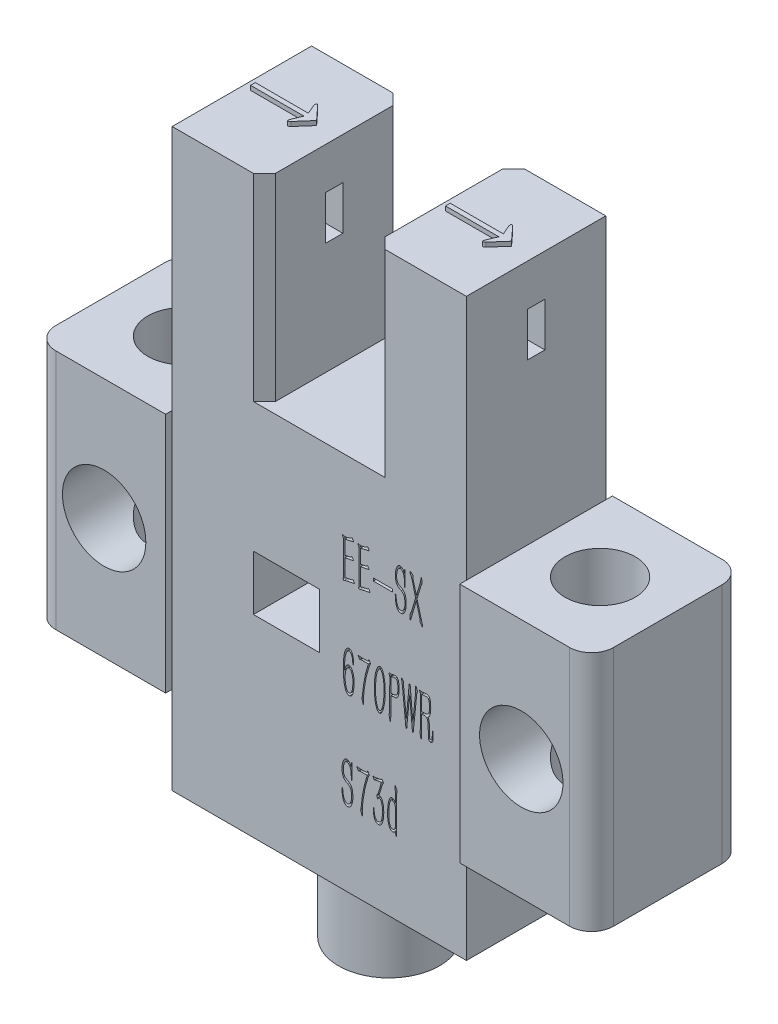
from build123d import *

# Parameters (mm, degrees)
SKETCH_1_W               = 3
SKETCH_1_H               = 2.5
EXTRUDE_1_DEPTH          = 3.175
SKETCH_1_3_W             = 6
SKETCH_1_3_H             = 11
SKETCH_1_3_R             = 1.9
EXTRUDE_2_DEPTH          = 3.475
FILLET_1_R               = 1
CHAMFER_1_SIZE           = 0.5
CUT_EXTRUDE_1_DEPTH      = 22.26630257
CUT_EXTRUDE_1_DEPTH_BACK = 22.26630257
SKETCH_2_W               = 0.8
SKETCH_2_H               = 2
EXTRUDE_3_DEPTH          = 0.2
SKETCH_4_R               = 2.3
EXTRUDE_4_DEPTH          = 4
SKETCH_5_R               = 1.6
CUT_EXTRUDE_3_DEPTH      = 19
SKETCH_6_W               = 0.860856595
SKETCH_6_H               = 0.12401449
CUT_EXTRUDE_4_DEPTH      = 2


with BuildPart() as part:
    # 草图1 → 凸台-拉伸1 (new, symmetric)
    with BuildSketch(Plane.XY):
        Polygon((-6.7, 5.5), (-6.7, -5.5), (-6.7, -9.5), (6.7, -9.5), (6.7, -5.5), (6.7, 5.5), (6.7, 16.7), (2.5, 16.7), (2.5, 7.7), (-2.5, 7.7), (-2.5, 16.7), (-6.7, 16.7), align=None)
        with Locations((-1.5, 0.55)):
            Rectangle(SKETCH_1_W, SKETCH_1_H, mode=Mode.SUBTRACT)
    extrude(amount=EXTRUDE_1_DEPTH, both=True)

    # 草图1<3> → 凸台-拉伸2 (add, symmetric)
    # profile 1 of 2: a face of its own
    with BuildSketch(Plane.XY):
        with Locations((-9.7, 0)):
            Rectangle(SKETCH_1_3_W, SKETCH_1_3_H)
        with Locations((-9.5, 0)):
            Circle(SKETCH_1_3_R, mode=Mode.SUBTRACT)
    # profile 2 of 2: a face of its own
    with BuildSketch(Plane.XY):
        with Locations((9.7, 0)):
            Rectangle(SKETCH_1_3_W, SKETCH_1_3_H)
        with Locations((9.5, 0)):
            Circle(SKETCH_1_3_R, mode=Mode.SUBTRACT)
    extrude(amount=EXTRUDE_2_DEPTH, both=True)

    # 圆角1
    fillet_1_edges = [part.edges().sort_by_distance(p)[0] for p in [
        (12.7, 0, 3.475),
        (12.7, 0, -3.475),
        (-12.7, 0, 3.475),
        (-12.7, 0, -3.475),
    ]]
    fillet(fillet_1_edges, radius=FILLET_1_R)

    # 倒角1
    chamfer_1_edges = [part.edges().sort_by_distance(p)[0] for p in [
        (2.5, 12.2, -3.175),
        (2.5, 12.2, 3.175),
        (-2.5, 12.2, -3.175),
        (-2.5, 12.2, 3.175),
    ]]
    chamfer(chamfer_1_edges, length=CHAMFER_1_SIZE)

    # 草图2 → 切除-拉伸1 (cut, two sides: drawn at the far end of the back side and taken through both)
    with BuildSketch(Plane(origin=(0, 0, 0), x_dir=(0, 0, -1), z_dir=(1, 0, 0)).offset(-CUT_EXTRUDE_1_DEPTH_BACK)):
        with Locations((0, 13.8)):
            Rectangle(SKETCH_2_W, SKETCH_2_H)
    extrude(amount=CUT_EXTRUDE_1_DEPTH + CUT_EXTRUDE_1_DEPTH_BACK, mode=Mode.SUBTRACT)

    # 草图3 → 凸台-拉伸3 (add)
    with BuildSketch(Plane(origin=(0, 16.7, 0), x_dir=(1, 0, 0), z_dir=(0, 1, 0))):
        with BuildLine():
            Line((-6.342765821, 0.033528944), (-6.342765821, 0.249808509))
            Line((-6.342765821, 0.249808509), (-3.921180482, 0.249808509))
            Line((-3.921180482, 0.249808509), (-4.087492009, 0.632399602))
            add(Edge.make_bspline(
                [(-4.087492009, 0.632399602), (-4.093661501, 0.647898129), (-4.10594745, 0.678761953), (-4.115864236, 0.725831043), (-4.118724974, 0.765673564), (-4.114711446, 0.798138269), (-4.091180661, 0.814271159), (-4.063437052, 0.802936482), (-4.034917117, 0.785651908), (-4.016617094, 0.76784721), (-4.006946516, 0.758438383)],
                knots=[0, 0, 0, 0, 1.361127672, 2.710554672, 3.889238455, 4.667095942, 5.224377679, 5.933251688, 6.907834593, 8, 8, 8, 8], degree=3))
            Line((-4.006946516, 0.758438383), (-3.447602813, 0.149126643))
            Line((-3.447602813, 0.149126643), (-3.991284892, -0.469880389))
            add(Edge.make_bspline(
                [(-3.991284892, -0.469880389), (-4.001773822, -0.480347189), (-4.022525279, -0.501054864), (-4.054084164, -0.518717952), (-4.07849851, -0.525772499), (-4.092795662, -0.528268888), (-4.104062491, -0.525390509), (-4.111216416, -0.517269608), (-4.112565935, -0.504646124), (-4.111458101, -0.488720192), (-4.10837618, -0.467931197), (-4.100627557, -0.436807254), (-4.090095486, -0.401485384), (-4.08084722, -0.374893574), (-4.077050927, -0.363977981)],
                knots=[0, 0, 0, 0, 1.783110913, 3.527733803, 4.277390177, 4.850276774, 5.258133937, 5.619216263, 6.077917761, 6.738296525, 7.556762003, 8.604136862, 10.606042242, 12, 12, 12, 12], degree=3))
            Line((-4.077050927, -0.363977981), (-3.910739399, 0.033528944))
            Line((-3.910739399, 0.033528944), (-6.342765821, 0.033528944))
        make_face()
        with BuildLine():
            Line((2.857234179, -0.285499863), (2.857234179, -0.069220298))
            Line((2.857234179, -0.069220298), (5.278819518, -0.069220298))
            Line((5.278819518, -0.069220298), (5.112507991, 0.313370795))
            add(Edge.make_bspline(
                [(5.112507991, 0.313370795), (5.106338499, 0.328869322), (5.09405255, 0.359733146), (5.084135764, 0.406802235), (5.081275026, 0.446644756), (5.085288554, 0.479109462), (5.108819339, 0.495242352), (5.136562948, 0.483907674), (5.165082883, 0.466623101), (5.183382906, 0.448818402), (5.193053484, 0.439409576)],
                knots=[0, 0, 0, 0, 1.361127672, 2.710554672, 3.889238455, 4.667095942, 5.224377679, 5.933251688, 6.907834593, 8, 8, 8, 8], degree=3))
            Line((5.193053484, 0.439409576), (5.752397187, -0.169902165))
            Line((5.752397187, -0.169902165), (5.208715108, -0.788909196))
            add(Edge.make_bspline(
                [(5.208715108, -0.788909196), (5.198226178, -0.799375996), (5.177474721, -0.820083671), (5.145915836, -0.837746759), (5.12150149, -0.844801306), (5.107204338, -0.847297695), (5.095937509, -0.844419316), (5.088783584, -0.836298416), (5.087434065, -0.823674931), (5.088541899, -0.807748999), (5.09162382, -0.786960005), (5.099372443, -0.755836061), (5.109904514, -0.720514191), (5.11915278, -0.693922381), (5.122949073, -0.683006789)],
                knots=[0, 0, 0, 0, 1.783110913, 3.527733803, 4.277390177, 4.850276774, 5.258133937, 5.619216263, 6.077917761, 6.738296525, 7.556762003, 8.604136862, 10.606042242, 12, 12, 12, 12], degree=3))
            Line((5.122949073, -0.683006789), (5.289260601, -0.285499863))
            Line((5.289260601, -0.285499863), (2.857234179, -0.285499863))
        make_face()
    extrude(amount=EXTRUDE_3_DEPTH)

    # 草图4 → 凸台-拉伸4 (add)
    with BuildSketch(Plane.XZ.offset(9.5)):
        Circle(SKETCH_4_R)
    extrude(amount=EXTRUDE_4_DEPTH)

    # 草图5 → 切除-拉伸3 (cut)
    with BuildSketch(Plane(origin=(0, 5.5, 0), x_dir=(1, 0, 0), z_dir=(0, 1, 0))):
        with Locations((-9.384641147, 0)):
            Circle(SKETCH_5_R)
        with Locations((9.615358853, 0)):
            Circle(SKETCH_5_R)
    extrude(amount=-CUT_EXTRUDE_3_DEPTH, mode=Mode.SUBTRACT)

    # 草图6 → 切除-拉伸4 (cut)
    # profile 1 of 15: a face of its own
    with BuildSketch(Plane.XY.offset(3.175)):
        with BuildLine():
            Line((1.163011282, 4.354576531), (1.163011282, 3.721719084))
            Line((1.163011282, 3.721719084), (1.331347102, 3.753255414))
            add(Edge.make_bspline(
                [(1.331347102, 3.753255414), (1.337322557, 3.754639208), (1.350617729, 3.757718099), (1.371272099, 3.763407374), (1.391972351, 3.770028835), (1.410595275, 3.777521346), (1.426588114, 3.785395861), (1.441315569, 3.793428145), (1.454640815, 3.802545768), (1.462004401, 3.810095335), (1.46558959, 3.813771076)],
                knots=[0, 0, 0, 0, 0.986113412, 2.194066712, 3.443627159, 4.478527157, 5.418320557, 6.307924505, 7.176160597, 8, 8, 8, 8], degree=3))
            Line((1.46558959, 3.813771076), (1.483488589, 3.828260741))
            Line((1.483488589, 3.828260741), (1.541447251, 3.744732082))
            add(Edge.make_bspline(
                [(1.541447251, 3.744732082), (1.544227898, 3.739761666), (1.548984041, 3.731260044), (1.551015931, 3.718433661), (1.549249087, 3.708546785), (1.545122183, 3.701371345), (1.539042976, 3.696227765), (1.534152982, 3.695894048), (1.531645418, 3.695722919)],
                knots=[0, 0, 0, 0, 1.672062868, 2.859971293, 3.757805337, 4.586153226, 5.274986487, 6, 6, 6, 6], degree=3))
            Line((1.531645418, 3.695722919), (1.163011282, 3.621143759))
            Line((1.163011282, 3.621143759), (1.163011282, 2.84168499))
            Line((1.163011282, 2.84168499), (1.461327924, 2.901774485))
            add(Edge.make_bspline(
                [(1.461327924, 2.901774485), (1.466044722, 2.903102425), (1.475665041, 2.905810873), (1.49000396, 2.911795363), (1.503918774, 2.920515061), (1.512943539, 2.927277952), (1.517581919, 2.930753816)],
                knots=[0, 0, 0, 0, 0.921231806, 1.878931967, 2.909852871, 4, 4, 4, 4], degree=3))
            Line((1.517581919, 2.930753816), (1.535480918, 2.945243482))
            Line((1.535480918, 2.945243482), (1.591734913, 2.855748489))
            add(Edge.make_bspline(
                [(1.591734913, 2.855748489), (1.594428453, 2.850802385), (1.599041284, 2.842331918), (1.600231597, 2.829344551), (1.597436651, 2.820822848), (1.595571538, 2.813543089), (1.588196923, 2.810004061), (1.582802473, 2.809831866), (1.579376081, 2.809722493)],
                knots=[0, 0, 0, 0, 1.671741077, 2.862945409, 3.737763228, 4.384112327, 4.973636761, 6, 6, 6, 6], degree=3))
            Line((1.579376081, 2.809722493), (1.549544417, 2.807165493))
            add(Edge.make_bspline(
                [(1.549544417, 2.807165493), (1.541157182, 2.80607099), (1.523066439, 2.803710216), (1.494222826, 2.798991216), (1.461752645, 2.792826354), (1.425606084, 2.786194949), (1.385984536, 2.778013054), (1.342805774, 2.768598789), (1.296113201, 2.757889858), (1.263729035, 2.750483543), (1.246966109, 2.746649832)],
                knots=[0, 0, 0, 0, 0.657591239, 1.418383361, 2.271891759, 3.227165249, 4.275524892, 5.417180625, 6.663062289, 8, 8, 8, 8], degree=3))
            Line((1.246966109, 2.746649832), (1.154914116, 2.723636834))
            add(Edge.make_bspline(
                [(1.154914116, 2.723636834), (1.147758332, 2.719690089), (1.135230161, 2.712780225), (1.117753805, 2.705072035), (1.101460036, 2.706489633), (1.089443097, 2.718433034), (1.084935774, 2.739050128), (1.086067971, 2.754624632), (1.086727455, 2.763696497)],
                knots=[0, 0, 0, 0, 1.253817519, 2.195152836, 2.874293131, 3.612392988, 4.609262392, 6, 6, 6, 6], degree=3))
            add(Edge.make_bspline(
                [(1.086727455, 2.763696497), (1.087099955, 2.766973194), (1.088146577, 2.776179801), (1.09238919, 2.792624812), (1.096827586, 2.813712697), (1.100410174, 2.839340732), (1.103573461, 2.871735618), (1.104507882, 2.896365513), (1.10505262, 2.910723985)],
                knots=[0, 0, 0, 0, 0.399517696, 1.122533575, 2.054882969, 3.012195706, 4.258202041, 6, 6, 6, 6], degree=3))
            Line((1.10505262, 2.910723985), (1.10505262, 2.965273313))
            add(Edge.make_bspline(
                [(1.10505262, 2.965273313), (1.105379441, 2.973227303), (1.105980444, 2.987854218), (1.106208399, 3.007750477), (1.106849787, 3.023796946), (1.10678552, 3.033175457), (1.106757287, 3.037295474)],
                knots=[0, 0, 0, 0, 1.32581929, 2.438103177, 3.313852465, 4, 4, 4, 4], degree=3))
            Line((1.106757287, 3.037295474), (1.10505262, 4.354576531))
            add(Edge.make_bspline(
                [(1.10505262, 4.354576531), (1.101133574, 4.361287168), (1.09325834, 4.374772042), (1.080760841, 4.393804597), (1.071513441, 4.412020581), (1.062711125, 4.426942851), (1.058052592, 4.44069238), (1.055089241, 4.453493294), (1.055565499, 4.464872721), (1.054181134, 4.474917655), (1.061519191, 4.483590516), (1.068700261, 4.482074671), (1.073090123, 4.48114802)],
                knots=[0, 0, 0, 0, 1.521817492, 3.058057719, 4.452238305, 5.522377007, 6.437380693, 7.288415137, 8.067785778, 8.680390137, 9.193309001, 10, 10, 10, 10], degree=3))
            Line((1.073090123, 4.48114802), (1.111018953, 4.472624688))
            add(Edge.make_bspline(
                [(1.111018953, 4.472624688), (1.119389875, 4.470974915), (1.133954564, 4.468104451), (1.153247874, 4.46536832), (1.167799621, 4.464294718), (1.175807853, 4.465954245), (1.179205614, 4.466658355)],
                knots=[0, 0, 0, 0, 1.483999226, 2.58203193, 3.398379434, 4, 4, 4, 4], degree=3))
            Line((1.179205614, 4.466658355), (1.185171947, 4.466658355))
            add(Edge.make_bspline(
                [(1.185171947, 4.466658355), (1.192698752, 4.466803896), (1.206905123, 4.467078596), (1.22733024, 4.467419435), (1.245921384, 4.470486717), (1.257508597, 4.473928884), (1.263160441, 4.475607854)],
                knots=[0, 0, 0, 0, 1.145512468, 2.162082652, 3.103527244, 4, 4, 4, 4], degree=3))
            Line((1.263160441, 4.475607854), (1.341148934, 4.495637686))
            add(Edge.make_bspline(
                [(1.341148934, 4.495637686), (1.348981098, 4.49725944), (1.362719324, 4.500104123), (1.381927313, 4.505217053), (1.39962611, 4.511064432), (1.417568407, 4.518625914), (1.435563365, 4.526692077), (1.451856989, 4.535020106), (1.465046946, 4.543746778), (1.472187285, 4.55025134), (1.475391423, 4.553170181)],
                knots=[0, 0, 0, 0, 1.299377813, 2.279210043, 3.228103997, 4.325412001, 5.441017758, 6.432202905, 7.296470708, 8, 8, 8, 8], degree=3))
            Line((1.475391423, 4.553170181), (1.493290421, 4.570216846))
            Line((1.493290421, 4.570216846), (1.55167525, 4.484131187))
            add(Edge.make_bspline(
                [(1.55167525, 4.484131187), (1.553886735, 4.47910522), (1.557547755, 4.470784945), (1.5599, 4.459159931), (1.558490066, 4.450296451), (1.554807846, 4.443594564), (1.548834864, 4.438616988), (1.543951444, 4.438278675), (1.541447251, 4.438105191)],
                knots=[0, 0, 0, 0, 1.726781547, 2.858613634, 3.674397486, 4.495066314, 5.228277577, 6, 6, 6, 6], degree=3))
            Line((1.541447251, 4.438105191), (1.509484753, 4.432138858))
            add(Edge.make_bspline(
                [(1.509484753, 4.432138858), (1.496548499, 4.42977456), (1.473937894, 4.425642128), (1.445346423, 4.419807891), (1.426812585, 4.416911806), (1.418000861, 4.415518842), (1.415301928, 4.415092193)],
                knots=[0, 0, 0, 0, 1.648643282, 2.88157777, 3.657439607, 4, 4, 4, 4], degree=3))
            Line((1.415301928, 4.415092193), (1.163011282, 4.354576531))
        make_face()
    # profile 2 of 15: a face of its own
    with BuildSketch(Plane.XY.offset(3.175)):
        with BuildLine():
            Line((1.872152556, 4.354576531), (1.872152556, 3.721719084))
            Line((1.872152556, 3.721719084), (2.040488376, 3.753255414))
            add(Edge.make_bspline(
                [(2.040488376, 3.753255414), (2.046463831, 3.754639208), (2.059759003, 3.757718099), (2.080413374, 3.763407374), (2.101113625, 3.770028835), (2.119736549, 3.777521346), (2.135729389, 3.785395861), (2.150456843, 3.793428145), (2.16378209, 3.802545768), (2.171145675, 3.810095335), (2.174730865, 3.813771076)],
                knots=[0, 0, 0, 0, 0.986113412, 2.194066712, 3.443627159, 4.478527157, 5.418320557, 6.307924505, 7.176160597, 8, 8, 8, 8], degree=3))
            Line((2.174730865, 3.813771076), (2.192629863, 3.828260741))
            Line((2.192629863, 3.828260741), (2.250588525, 3.744732082))
            add(Edge.make_bspline(
                [(2.250588525, 3.744732082), (2.253369172, 3.739761666), (2.258125315, 3.731260044), (2.260157205, 3.718433661), (2.258390361, 3.708546785), (2.254263457, 3.701371345), (2.24818425, 3.696227765), (2.243294256, 3.695894048), (2.240786692, 3.695722919)],
                knots=[0, 0, 0, 0, 1.672062868, 2.859971293, 3.757805337, 4.586153226, 5.274986487, 6, 6, 6, 6], degree=3))
            Line((2.240786692, 3.695722919), (1.872152556, 3.621143759))
            Line((1.872152556, 3.621143759), (1.872152556, 2.84168499))
            Line((1.872152556, 2.84168499), (2.170469198, 2.901774485))
            add(Edge.make_bspline(
                [(2.170469198, 2.901774485), (2.175185997, 2.903102425), (2.184806315, 2.905810873), (2.199145234, 2.911795363), (2.213060048, 2.920515061), (2.222084813, 2.927277952), (2.226723194, 2.930753816)],
                knots=[0, 0, 0, 0, 0.921231806, 1.878931967, 2.909852871, 4, 4, 4, 4], degree=3))
            Line((2.226723194, 2.930753816), (2.244622192, 2.945243482))
            Line((2.244622192, 2.945243482), (2.300876187, 2.855748489))
            add(Edge.make_bspline(
                [(2.300876187, 2.855748489), (2.303569728, 2.850802385), (2.308182558, 2.842331918), (2.309372871, 2.829344551), (2.306577925, 2.820822848), (2.304712812, 2.813543089), (2.297338198, 2.810004061), (2.291943748, 2.809831866), (2.288517355, 2.809722493)],
                knots=[0, 0, 0, 0, 1.671741077, 2.862945409, 3.737763228, 4.384112327, 4.973636761, 6, 6, 6, 6], degree=3))
            Line((2.288517355, 2.809722493), (2.258685691, 2.807165493))
            add(Edge.make_bspline(
                [(2.258685691, 2.807165493), (2.250298456, 2.80607099), (2.232207713, 2.803710216), (2.2033641, 2.798991216), (2.170893919, 2.792826354), (2.134747358, 2.786194949), (2.09512581, 2.778013054), (2.051947048, 2.768598789), (2.005254475, 2.757889858), (1.972870309, 2.750483543), (1.956107383, 2.746649832)],
                knots=[0, 0, 0, 0, 0.657591239, 1.418383361, 2.271891759, 3.227165249, 4.275524892, 5.417180625, 6.663062289, 8, 8, 8, 8], degree=3))
            Line((1.956107383, 2.746649832), (1.86405539, 2.723636834))
            add(Edge.make_bspline(
                [(1.86405539, 2.723636834), (1.856899606, 2.719690089), (1.844371435, 2.712780225), (1.82689508, 2.705072035), (1.81060131, 2.706489633), (1.798584371, 2.718433034), (1.794077048, 2.739050128), (1.795209245, 2.754624632), (1.795868729, 2.763696497)],
                knots=[0, 0, 0, 0, 1.253817519, 2.195152836, 2.874293131, 3.612392988, 4.609262392, 6, 6, 6, 6], degree=3))
            add(Edge.make_bspline(
                [(1.795868729, 2.763696497), (1.79624123, 2.766973194), (1.797287851, 2.776179801), (1.801530465, 2.792624812), (1.80596886, 2.813712697), (1.809551448, 2.839340732), (1.812714735, 2.871735618), (1.813649156, 2.896365513), (1.814193895, 2.910723985)],
                knots=[0, 0, 0, 0, 0.399517696, 1.122533575, 2.054882969, 3.012195706, 4.258202041, 6, 6, 6, 6], degree=3))
            Line((1.814193895, 2.910723985), (1.814193895, 2.965273313))
            add(Edge.make_bspline(
                [(1.814193895, 2.965273313), (1.814520715, 2.973227303), (1.815121718, 2.987854218), (1.815349674, 3.007750477), (1.815991061, 3.023796946), (1.815926794, 3.033175457), (1.815898561, 3.037295474)],
                knots=[0, 0, 0, 0, 1.32581929, 2.438103177, 3.313852465, 4, 4, 4, 4], degree=3))
            Line((1.815898561, 3.037295474), (1.814193895, 4.354576531))
            add(Edge.make_bspline(
                [(1.814193895, 4.354576531), (1.810274848, 4.361287168), (1.802399614, 4.374772042), (1.789902115, 4.393804597), (1.780654716, 4.412020581), (1.771852399, 4.426942851), (1.767193867, 4.44069238), (1.764230515, 4.453493294), (1.764706774, 4.464872721), (1.763322408, 4.474917655), (1.770660465, 4.483590516), (1.777841535, 4.482074671), (1.782231397, 4.48114802)],
                knots=[0, 0, 0, 0, 1.521817492, 3.058057719, 4.452238305, 5.522377007, 6.437380693, 7.288415137, 8.067785778, 8.680390137, 9.193309001, 10, 10, 10, 10], degree=3))
            Line((1.782231397, 4.48114802), (1.820160227, 4.472624688))
            add(Edge.make_bspline(
                [(1.820160227, 4.472624688), (1.828531149, 4.470974915), (1.843095838, 4.468104451), (1.862389149, 4.46536832), (1.876940895, 4.464294718), (1.884949127, 4.465954245), (1.888346888, 4.466658355)],
                knots=[0, 0, 0, 0, 1.483999226, 2.58203193, 3.398379434, 4, 4, 4, 4], degree=3))
            Line((1.888346888, 4.466658355), (1.894313221, 4.466658355))
            add(Edge.make_bspline(
                [(1.894313221, 4.466658355), (1.901840027, 4.466803896), (1.916046398, 4.467078596), (1.936471514, 4.467419435), (1.955062658, 4.470486717), (1.966649871, 4.473928884), (1.972301715, 4.475607854)],
                knots=[0, 0, 0, 0, 1.145512468, 2.162082652, 3.103527244, 4, 4, 4, 4], degree=3))
            Line((1.972301715, 4.475607854), (2.050290208, 4.495637686))
            add(Edge.make_bspline(
                [(2.050290208, 4.495637686), (2.058122372, 4.49725944), (2.071860599, 4.500104123), (2.091068587, 4.505217053), (2.108767384, 4.511064432), (2.126709681, 4.518625914), (2.14470464, 4.526692077), (2.160998263, 4.535020106), (2.174188221, 4.543746778), (2.181328559, 4.55025134), (2.184532697, 4.553170181)],
                knots=[0, 0, 0, 0, 1.299377813, 2.279210043, 3.228103997, 4.325412001, 5.441017758, 6.432202905, 7.296470708, 8, 8, 8, 8], degree=3))
            Line((2.184532697, 4.553170181), (2.202431696, 4.570216846))
            Line((2.202431696, 4.570216846), (2.260816524, 4.484131187))
            add(Edge.make_bspline(
                [(2.260816524, 4.484131187), (2.263028009, 4.47910522), (2.266689029, 4.470784945), (2.269041274, 4.459159931), (2.267631341, 4.450296451), (2.263949121, 4.443594564), (2.257976138, 4.438616988), (2.253092718, 4.438278675), (2.250588525, 4.438105191)],
                knots=[0, 0, 0, 0, 1.726781547, 2.858613634, 3.674397486, 4.495066314, 5.228277577, 6, 6, 6, 6], degree=3))
            Line((2.250588525, 4.438105191), (2.218626028, 4.432138858))
            add(Edge.make_bspline(
                [(2.218626028, 4.432138858), (2.205689773, 4.42977456), (2.183079168, 4.425642128), (2.154487698, 4.419807891), (2.135953859, 4.416911806), (2.127142136, 4.415518842), (2.124443202, 4.415092193)],
                knots=[0, 0, 0, 0, 1.648643282, 2.88157777, 3.657439607, 4, 4, 4, 4], degree=3))
            Line((2.124443202, 4.415092193), (1.872152556, 4.354576531))
        make_face()
    # profile 3 of 15: a face of its own
    with BuildSketch(Plane.XY.offset(3.175)):
        with Locations((2.893673972, 3.412535193)):
            Rectangle(SKETCH_6_W, SKETCH_6_H)
    # profile 4 of 15: a face of its own
    with BuildSketch(Plane.XY.offset(3.175)):
        with BuildLine():
            Line((3.874709556, 4.36608303), (3.894739388, 4.541663682))
            Line((3.894739388, 4.541663682), (3.91476922, 4.538680516))
            Line((3.91476922, 4.538680516), (3.91476922, 3.819737409))
            Line((3.91476922, 3.819737409), (3.890903888, 3.816754242))
            Line((3.890903888, 3.816754242), (3.876840389, 4.121463384))
            add(Edge.make_bspline(
                [(3.876840389, 4.121463384), (3.874954148, 4.138380103), (3.871476076, 4.16957313), (3.865281602, 4.212115402), (3.85846573, 4.246510101), (3.849666316, 4.281593819), (3.83564935, 4.318807477), (3.814759811, 4.358822816), (3.790224587, 4.395102477), (3.760389717, 4.423597811), (3.728465919, 4.446103612), (3.704250785, 4.450502954), (3.692736405, 4.452594856)],
                knots=[0, 0, 0, 0, 1.257260182, 2.318283601, 3.17433525, 3.846205235, 4.988336011, 6.100627212, 7.177716735, 8.201723922, 9.144913497, 10, 10, 10, 10], degree=3))
            add(Edge.make_bspline(
                [(3.692736405, 4.452594856), (3.685866011, 4.45218247), (3.671657364, 4.451329616), (3.654104892, 4.445271249), (3.639191097, 4.437647711), (3.627448605, 4.427113467), (3.613681706, 4.414135424), (3.594315107, 4.390956192), (3.571387995, 4.355416533), (3.552173716, 4.305469109), (3.538767275, 4.252078363), (3.530759405, 4.206345997), (3.527641479, 4.16793703), (3.525483667, 4.135404533), (3.523799514, 4.098892172), (3.522770245, 4.059387914), (3.523805488, 4.018788139), (3.528123419, 3.979192869), (3.534985395, 3.941384368), (3.542745821, 3.917544156), (3.54656125, 3.905823068)],
                knots=[0, 0, 0, 0, 0.596431335, 1.23347835, 1.598428839, 2.046253567, 2.596878615, 3.245685297, 4.668449098, 6.2542789, 7.875965991, 9.454652379, 10.286004482, 11.227302492, 12.291306866, 13.465651409, 14.665026572, 15.821018805, 16.928699511, 18, 18, 18, 18], degree=3))
            add(Edge.make_bspline(
                [(3.54656125, 3.905823068), (3.550768264, 3.895088333), (3.558802302, 3.874588453), (3.5733926, 3.846487703), (3.591187727, 3.823588218), (3.61594095, 3.800242196), (3.64609013, 3.779389698), (3.66994354, 3.765359069), (3.680377572, 3.759221747)],
                knots=[0, 0, 0, 0, 1.016366184, 1.940931494, 2.780125772, 3.559631215, 4.932526376, 6, 6, 6, 6], degree=3))
            Line((3.680377572, 3.759221747), (3.750695067, 3.718735917))
            add(Edge.make_bspline(
                [(3.750695067, 3.718735917), (3.767463966, 3.707476161), (3.798947231, 3.6863362), (3.839676171, 3.650137667), (3.872762019, 3.611704017), (3.899025421, 3.569113104), (3.920417747, 3.520865186), (3.933588889, 3.465456716), (3.944114824, 3.404635558), (3.951755175, 3.338607404), (3.956249773, 3.2663465), (3.958333736, 3.18904179), (3.957398947, 3.109443939), (3.950237111, 3.056998706), (3.946731717, 3.031329141)],
                knots=[0, 0, 0, 0, 0.958177598, 1.798958794, 2.578851563, 3.357459884, 4.166978775, 5.07332933, 6.05250118, 7.098310875, 8.227175818, 9.488951711, 10.770955651, 12, 12, 12, 12], degree=3))
            add(Edge.make_bspline(
                [(3.946731717, 3.031329141), (3.942345289, 3.005769849), (3.933957484, 2.95689492), (3.915945131, 2.899207191), (3.899731867, 2.858416741), (3.887627558, 2.832395496), (3.876353043, 2.809488383), (3.860572193, 2.784043356), (3.837295361, 2.75631817), (3.809177956, 2.733518228), (3.783230505, 2.719226317), (3.761701766, 2.711417543), (3.738488843, 2.707334839), (3.722582024, 2.706559406), (3.714470903, 2.706164002)],
                knots=[0, 0, 0, 0, 2.142160148, 4.096276307, 4.981756149, 5.77006979, 6.46867297, 7.091155996, 8.241562957, 9.444834248, 10.059736611, 10.683879447, 11.328890732, 12, 12, 12, 12], degree=3))
            add(Edge.make_bspline(
                [(3.714470903, 2.706164002), (3.705347068, 2.706243099), (3.68744951, 2.706398257), (3.661188786, 2.712634492), (3.636478032, 2.723973275), (3.613479013, 2.74042702), (3.592173864, 2.761250178), (3.572124282, 2.785524889), (3.553987083, 2.813685171), (3.5361505, 2.844648157), (3.521245657, 2.879729696), (3.507465853, 2.917827061), (3.495709655, 2.959160395), (3.482180693, 3.017735062), (3.471133351, 3.092035078), (3.467980983, 3.151756324), (3.466441924, 3.180913629)],
                knots=[0, 0, 0, 0, 0.653822689, 1.282556056, 1.921883338, 2.595707611, 3.303009644, 4.056920805, 4.852238785, 5.706641099, 6.620524083, 7.585671337, 8.61594932, 9.705138692, 11.903148548, 14, 14, 14, 14], degree=3))
            Line((3.466441924, 3.180913629), (3.458344758, 3.333481283))
            Line((3.458344758, 3.333481283), (3.486471755, 3.333481283))
            add(Edge.make_bspline(
                [(3.486471755, 3.333481283), (3.488140735, 3.315436706), (3.49134849, 3.28075528), (3.496563313, 3.230618795), (3.501475773, 3.184408346), (3.508631583, 3.129436725), (3.519290636, 3.0674914), (3.535232686, 2.99997067), (3.55692696, 2.941094021), (3.580010983, 2.89841537), (3.600479343, 2.869533201), (3.616078815, 2.852111425), (3.631704955, 2.838266473), (3.652406722, 2.825498091), (3.678808002, 2.815624878), (3.700327579, 2.815668115), (3.710635403, 2.815688826)],
                knots=[0, 0, 0, 0, 1.245234439, 2.39332329, 3.463757188, 4.438443551, 6.202147339, 7.781282023, 9.199123453, 10.500923388, 11.102346915, 11.62765803, 12.105174835, 12.530445489, 13.296087005, 14, 14, 14, 14], degree=3))
            add(Edge.make_bspline(
                [(3.710635403, 2.815688826), (3.719634949, 2.816189501), (3.73722946, 2.817168344), (3.762253937, 2.824535963), (3.784840598, 2.836842921), (3.804434955, 2.854486624), (3.822280045, 2.875787316), (3.837924648, 2.900982146), (3.852642764, 2.929215186), (3.868883298, 2.97127045), (3.885397415, 3.024413262), (3.894982827, 3.078362898), (3.898769813, 3.121495631), (3.90112123, 3.156018546), (3.901231542, 3.193560441), (3.900886056, 3.219412053), (3.900705721, 3.232905958)],
                knots=[0, 0, 0, 0, 0.750368542, 1.467003838, 2.156850702, 2.879639164, 3.653890487, 4.469611426, 5.349905873, 6.307681137, 8.228142682, 9.986494284, 10.867826204, 11.841902718, 12.873526388, 14, 14, 14, 14], degree=3))
            add(Edge.make_bspline(
                [(3.900705721, 3.232905958), (3.899641145, 3.253946064), (3.897659208, 3.293116734), (3.891826943, 3.347199918), (3.884116748, 3.392466385), (3.87360127, 3.429563245), (3.861776007, 3.460884485), (3.848464583, 3.488381652), (3.833783287, 3.513047422), (3.81138165, 3.542337031), (3.777549874, 3.575562282), (3.745306433, 3.59601515), (3.728534402, 3.606654093)],
                knots=[0, 0, 0, 0, 1.458078527, 2.714525818, 3.763834507, 4.632380494, 5.379354667, 6.078655678, 6.74481285, 7.362382767, 8.627993911, 10, 10, 10, 10], degree=3))
            Line((3.728534402, 3.606654093), (3.642448742, 3.652680089))
            add(Edge.make_bspline(
                [(3.642448742, 3.652680089), (3.628944098, 3.661230302), (3.601488394, 3.678613368), (3.565094394, 3.712742146), (3.53365533, 3.754108044), (3.508255841, 3.803454322), (3.488975966, 3.86097212), (3.477246917, 3.914680293), (3.470603709, 3.963092844), (3.46723748, 4.004489975), (3.466211986, 4.050146434), (3.466362808, 4.081830218), (3.466441924, 4.098450386)],
                knots=[0, 0, 0, 0, 0.948666273, 1.928692063, 2.947224964, 4.023801431, 5.212319046, 6.544224981, 7.285927689, 8.116326121, 9.011892806, 10, 10, 10, 10], degree=3))
            add(Edge.make_bspline(
                [(3.466441924, 4.098450386), (3.466678496, 4.112798385), (3.467135402, 4.140509434), (3.468567092, 4.180623043), (3.472020952, 4.217588368), (3.478247974, 4.262530397), (3.489241079, 4.315329038), (3.507002886, 4.374502862), (3.526929614, 4.427291525), (3.549887421, 4.471698571), (3.576812849, 4.506719163), (3.601453394, 4.530964515), (3.62396997, 4.545718009), (3.643020312, 4.553508039), (3.664296359, 4.557594847), (3.679083021, 4.558328795), (3.686770072, 4.558710347)],
                knots=[0, 0, 0, 0, 1.083995577, 2.093577831, 3.031072132, 3.886961907, 5.520047826, 7.098748522, 8.549434661, 9.778396124, 10.857921158, 11.875116148, 12.372207107, 12.882330483, 13.418964071, 14, 14, 14, 14], degree=3))
            add(Edge.make_bspline(
                [(3.686770072, 4.558710347), (3.695362649, 4.557290833), (3.712666327, 4.554432224), (3.737696209, 4.544810589), (3.761566102, 4.530271079), (3.791191253, 4.505461511), (3.824542309, 4.47050051), (3.842285434, 4.436859736), (3.850844225, 4.420632359)],
                knots=[0, 0, 0, 0, 0.70105527, 1.411780724, 2.146660815, 2.944737703, 4.526226144, 6, 6, 6, 6], degree=3))
            Line((3.850844225, 4.420632359), (3.874709556, 4.36608303))
        make_face()
    # profile 5 of 15: a face of its own
    with BuildSketch(Plane.XY.offset(3.175)):
        with BuildLine():
            Line((4.421481344, 3.759221747), (4.573622831, 4.262524539))
            add(Edge.make_bspline(
                [(4.573622831, 4.262524539), (4.575334386, 4.269057168), (4.579124148, 4.283521864), (4.585218421, 4.307468058), (4.59138173, 4.335967621), (4.59832208, 4.367365172), (4.605361579, 4.398712493), (4.611209717, 4.427007109), (4.616016207, 4.450567989), (4.620571734, 4.475829855), (4.62527845, 4.504586063), (4.626922113, 4.527296822), (4.627745993, 4.538680516)],
                knots=[0, 0, 0, 0, 0.71909675, 1.592240205, 2.630791366, 3.823566194, 5.016341022, 6.051692729, 6.900115792, 7.576585111, 8.785271293, 10, 10, 10, 10], degree=3))
            Line((4.627745993, 4.538680516), (4.631581493, 4.587689678))
            Line((4.631581493, 4.587689678), (4.655446824, 4.593229844))
            Line((4.655446824, 4.593229844), (4.687835488, 4.351593365))
            add(Edge.make_bspline(
                [(4.687835488, 4.351593365), (4.683683584, 4.345364224), (4.676099204, 4.333985309), (4.665629023, 4.317269899), (4.655927419, 4.300085591), (4.64719474, 4.283260279), (4.638796103, 4.263990014), (4.631759081, 4.240771885), (4.621461239, 4.210049625), (4.615102712, 4.186568971), (4.611551661, 4.173455713)],
                knots=[0, 0, 0, 0, 0.920942289, 1.682306714, 2.425811492, 3.348079355, 4.013549348, 5.008306296, 6.329226517, 8, 8, 8, 8], degree=3))
            Line((4.611551661, 4.173455713), (4.449182175, 3.647139923))
            Line((4.449182175, 3.647139923), (4.651611325, 2.910723985))
            Line((4.651611325, 2.910723985), (4.691670988, 2.761139497))
            add(Edge.make_bspline(
                [(4.691670988, 2.761139497), (4.695841819, 2.748017265), (4.703375916, 2.724313556), (4.708358201, 2.695515495), (4.709666927, 2.676909103), (4.709677055, 2.66723231), (4.709306398, 2.660320013), (4.706616557, 2.655105606), (4.702101111, 2.652992929), (4.696964492, 2.648088033), (4.688475476, 2.657627818), (4.681314041, 2.668429811), (4.673816932, 2.681952274), (4.669228015, 2.689699279), (4.667805657, 2.692100503)],
                knots=[0, 0, 0, 0, 2.896930452, 5.232951034, 6.132380622, 6.820416033, 7.273105819, 7.581095303, 7.987977623, 8.336838613, 8.851508561, 10.096472863, 11.409992197, 12, 12, 12, 12], degree=3))
            Line((4.667805657, 2.692100503), (4.617517994, 2.755173164))
            add(Edge.make_bspline(
                [(4.617517994, 2.755173164), (4.613316959, 2.759793879), (4.605844998, 2.768012281), (4.597171969, 2.779476735), (4.591139026, 2.787432156), (4.587459711, 2.795610952), (4.588429611, 2.807846579), (4.588597318, 2.826428242), (4.588464651, 2.852128147), (4.586586476, 2.871248817), (4.585555497, 2.881744654)],
                knots=[0, 0, 0, 0, 1.096785602, 1.950742629, 2.52549533, 2.850048936, 3.499636079, 4.62336823, 6.146478233, 8, 8, 8, 8], degree=3))
            add(Edge.make_bspline(
                [(4.585555497, 2.881744654), (4.584263964, 2.891401787), (4.581888663, 2.909162541), (4.579049232, 2.93167946), (4.575331463, 2.951380186), (4.571262152, 2.97223384), (4.563979452, 2.999479885), (4.556203643, 3.031341734), (4.548203715, 3.06283277), (4.541750622, 3.089559401), (4.53721223, 3.108915348), (4.534566004, 3.119405642), (4.533563168, 3.123381134)],
                knots=[0, 0, 0, 0, 1.181529803, 2.172990688, 2.750742249, 3.612175662, 4.74851832, 6.168946643, 7.589374965, 8.688149819, 9.502850087, 10, 10, 10, 10], degree=3))
            Line((4.533563168, 3.123381134), (4.417219678, 3.546138432))
            Line((4.417219678, 3.546138432), (4.225018527, 2.881744654))
            Line((4.225018527, 2.881744654), (4.176861698, 2.723636834))
            add(Edge.make_bspline(
                [(4.176861698, 2.723636834), (4.173142512, 2.712413158), (4.166492261, 2.692344184), (4.157513003, 2.669153907), (4.149092758, 2.657366066), (4.146796998, 2.651200226), (4.141412103, 2.650018387), (4.141190607, 2.652929767), (4.141063701, 2.654597839)],
                knots=[0, 0, 0, 0, 2.470443849, 4.417383057, 5.107556189, 5.510036335, 5.7192758, 6, 6, 6, 6], degree=3))
            add(Edge.make_bspline(
                [(4.141063701, 2.654597839), (4.140295248, 2.65541655), (4.137783315, 2.658092768), (4.136475257, 2.66568113), (4.135806729, 2.675710752), (4.135870873, 2.690141423), (4.137299645, 2.711817853), (4.136993194, 2.729594589), (4.136802034, 2.740683499)],
                knots=[0, 0, 0, 0, 0.228984026, 0.748507401, 1.513037741, 2.333952947, 3.713164784, 6, 6, 6, 6], degree=3))
            Line((4.136802034, 2.740683499), (4.141063701, 2.855748489))
            add(Edge.make_bspline(
                [(4.141063701, 2.855748489), (4.141296621, 2.864839354), (4.141704488, 2.880758337), (4.142851565, 2.901546066), (4.144497664, 2.915869008), (4.146533106, 2.928072476), (4.154056337, 2.940147952), (4.163712714, 2.955440616), (4.174607607, 2.97093933), (4.183092224, 2.986598276), (4.190086577, 3.002627705), (4.197084703, 3.017835263), (4.203560277, 3.034401155), (4.210674682, 3.052636496), (4.217223046, 3.077014203), (4.226029872, 3.104722448), (4.234251055, 3.132942296), (4.242135776, 3.15797913), (4.247881181, 3.178401536), (4.251563817, 3.190295001), (4.253145525, 3.195403294)],
                knots=[0, 0, 0, 0, 1.35733917, 2.376832222, 3.102537463, 3.514129657, 4.206239548, 5.188239152, 6.228889839, 7.025723248, 7.841504994, 8.838040073, 9.522970884, 10.495544545, 11.756429225, 13.285338192, 14.8345391, 16.142135705, 17.202039527, 18, 18, 18, 18], degree=3))
            Line((4.253145525, 3.195403294), (4.387388013, 3.652680089))
            Line((4.387388013, 3.652680089), (4.235246526, 4.248034873))
            add(Edge.make_bspline(
                [(4.235246526, 4.248034873), (4.230148373, 4.263950505), (4.219088622, 4.29847731), (4.20474298, 4.342277021), (4.193830677, 4.37837361), (4.185083473, 4.401642632), (4.178015489, 4.420672736), (4.169110446, 4.440474203), (4.157929505, 4.463874709), (4.149409052, 4.482693688), (4.1448992, 4.492654519)],
                knots=[0, 0, 0, 0, 1.535962007, 3.332061426, 4.236329686, 5.00041652, 5.616270051, 6.101457175, 6.995106694, 8, 8, 8, 8], degree=3))
            Line((4.1448992, 4.492654519), (4.127000202, 4.527174017))
            Line((4.127000202, 4.527174017), (4.136802034, 4.570216846))
            Line((4.136802034, 4.570216846), (4.255276358, 4.510127351))
            add(Edge.make_bspline(
                [(4.255276358, 4.510127351), (4.255956599, 4.49876821), (4.257197596, 4.478045173), (4.257376512, 4.447705391), (4.260670143, 4.416319102), (4.264056205, 4.386715888), (4.26905739, 4.358075293), (4.274085676, 4.332022414), (4.281082025, 4.302679023), (4.286226189, 4.281981205), (4.288943522, 4.271047871)],
                knots=[0, 0, 0, 0, 1.127867626, 2.057624071, 3.004810016, 4.253559485, 5.010522874, 5.885911102, 6.883262048, 8, 8, 8, 8], degree=3))
            Line((4.288943522, 4.271047871), (4.421481344, 3.759221747))
        make_face()
    # profile 6 of 15: a face of its own
    with BuildSketch(Plane.XY.offset(3.175)):
        with BuildLine():
            Line((1.559346249, -0.40900753), (1.531645418, -0.40900753))
            add(Edge.make_bspline(
                [(1.531645418, -0.40900753), (1.529887501, -0.391823647), (1.5264031, -0.357763136), (1.52207176, -0.306035332), (1.518469979, -0.252154841), (1.510746601, -0.195316138), (1.49929473, -0.136638567), (1.483537119, -0.089091889), (1.468448252, -0.053525756), (1.455441355, -0.030112963), (1.440652968, -0.010242334), (1.425119296, 0.006676272), (1.407943216, 0.019377536), (1.390198261, 0.029061637), (1.370905691, 0.03324292), (1.351366335, 0.033034362), (1.332344911, 0.029702271), (1.314728521, 0.02333688), (1.299038961, 0.014018427), (1.284250413, 0.002184885), (1.270814177, -0.014565672), (1.257238769, -0.036270424), (1.242856631, -0.063618765), (1.22807888, -0.09653551), (1.214076131, -0.134968061), (1.201509516, -0.178434922), (1.189943544, -0.226610939), (1.177002218, -0.2981484), (1.164655976, -0.393902469), (1.157768374, -0.491745644), (1.154456113, -0.568666227), (1.152884635, -0.620242245), (1.151365652, -0.664983241), (1.151168874, -0.692549379), (1.151078617, -0.705193339)],
                knots=[0, 0, 0, 0, 1.253709131, 2.485001292, 3.767672909, 5.17192919, 6.646063973, 8.100268023, 8.797515137, 9.448475839, 10.038259548, 10.592546998, 11.108079593, 11.583041538, 12.048279357, 12.522569344, 12.993823664, 13.443963629, 13.873684091, 14.313309782, 14.811005707, 15.423079908, 16.1702999, 17.051785263, 18.040156846, 19.136388148, 20.334288897, 21.634617038, 24.41111306, 27.337050081, 28.750963426, 29.999233815, 31.082294058, 32, 32, 32, 32], degree=3))
            Line((1.151078617, -0.705193339), (1.148947783, -0.817275163))
            add(Edge.make_bspline(
                [(1.148947783, -0.817275163), (1.153988485, -0.797228837), (1.163063938, -0.761136743), (1.176634502, -0.711320561), (1.192179491, -0.668925707), (1.210391814, -0.630186746), (1.233331457, -0.593938733), (1.257429198, -0.56715708), (1.279995945, -0.548399258), (1.300193578, -0.537900315), (1.322822487, -0.530485755), (1.338822892, -0.528226546), (1.347115267, -0.527055687)],
                knots=[0, 0, 0, 0, 1.649710448, 2.970195301, 4.117919237, 5.248665658, 6.380718349, 7.528386298, 8.10909378, 8.712591216, 9.332787079, 10, 10, 10, 10], degree=3))
            add(Edge.make_bspline(
                [(1.347115267, -0.527055687), (1.359343889, -0.527724373), (1.382904316, -0.529012705), (1.416441329, -0.543843786), (1.447262155, -0.569058642), (1.470035989, -0.599094227), (1.48905918, -0.628730816), (1.503394351, -0.655983111), (1.517086711, -0.687058829), (1.534674582, -0.733913812), (1.553634999, -0.797623468), (1.566808233, -0.864969396), (1.574695261, -0.921995806), (1.578941643, -0.96835363), (1.581336337, -1.017691963), (1.582890846, -1.086741576), (1.582824986, -1.172897123), (1.579363506, -1.241461476), (1.577671414, -1.274978125)],
                knots=[0, 0, 0, 0, 0.691319496, 1.331939231, 2.044680966, 2.935292261, 3.461878439, 4.047257723, 4.683688018, 5.391791821, 6.891961815, 8.457073237, 9.288698977, 10.164796593, 11.103034891, 12.096858343, 14.092008115, 16, 16, 16, 16], degree=3))
            add(Edge.make_bspline(
                [(1.577671414, -1.274978125), (1.575794143, -1.29232276), (1.571908428, -1.328223957), (1.563637813, -1.383771328), (1.553281671, -1.442691308), (1.542128267, -1.502865505), (1.528916378, -1.559594443), (1.511291001, -1.607906381), (1.490403773, -1.646078122), (1.465494755, -1.67321675), (1.440384025, -1.691086318), (1.418424392, -1.704479563), (1.39941542, -1.714404117), (1.386826781, -1.716728089), (1.381208597, -1.717765255)],
                knots=[0, 0, 0, 0, 1.217050051, 2.519139273, 3.917121236, 5.390464375, 6.789429645, 7.97491784, 8.969409026, 9.804094293, 10.519663479, 11.111163447, 11.60332117, 12, 12, 12, 12], degree=3))
            add(Edge.make_bspline(
                [(1.381208597, -1.717765255), (1.371243424, -1.718973406), (1.351178177, -1.721406063), (1.325725092, -1.714529772), (1.30555079, -1.704586868), (1.289396981, -1.692318833), (1.270868297, -1.677783), (1.252077471, -1.658454078), (1.232727239, -1.635933928), (1.215915504, -1.608493223), (1.200011914, -1.577819758), (1.181561356, -1.531391587), (1.162665196, -1.469788895), (1.144901284, -1.405838751), (1.133637467, -1.349442281), (1.125771874, -1.298806826), (1.118026785, -1.239999069), (1.111818506, -1.175854181), (1.106078722, -1.112488388), (1.10151897, -1.055643119), (1.097491138, -1.008363597), (1.094118473, -0.958084787), (1.091443682, -0.902255882), (1.090819483, -0.836453248), (1.091217449, -0.767120135), (1.092461207, -0.719113318), (1.093119955, -0.69368684)],
                knots=[0, 0, 0, 0, 0.628418555, 1.265344224, 1.626089432, 2.043893751, 2.540823498, 3.111211753, 3.741226173, 4.410080701, 5.135623685, 5.919547359, 7.557850633, 9.199240103, 10.104481564, 11.184562446, 12.431904173, 13.846350056, 15.250163964, 16.446284709, 17.444418885, 18.243917548, 19.625611868, 20.970149377, 22.395260653, 24, 24, 24, 24], degree=3))
            add(Edge.make_bspline(
                [(1.093119955, -0.69368684), (1.093564541, -0.673373761), (1.094400887, -0.63516131), (1.095301534, -0.581439705), (1.09769728, -0.535147713), (1.100314432, -0.481950881), (1.106572429, -0.416914002), (1.114407879, -0.337119714), (1.12503, -0.257330412), (1.138294015, -0.180190918), (1.157098815, -0.104250411), (1.178491776, -0.040642223), (1.198827488, 0.009707329), (1.216598702, 0.043166394), (1.234661759, 0.072145426), (1.254677589, 0.096134656), (1.277378814, 0.114540848), (1.302577378, 0.127862667), (1.331124707, 0.134760943), (1.350917625, 0.134774212), (1.361178766, 0.134781091)],
                knots=[0, 0, 0, 0, 1.173625354, 2.20779433, 3.103119585, 3.850934046, 5.283962899, 6.876078575, 8.482151674, 9.932367214, 11.395087135, 12.996058743, 13.805234198, 14.52828469, 15.18152656, 15.775155076, 16.323627097, 16.859431766, 17.408701119, 18, 18, 18, 18], degree=3))
            add(Edge.make_bspline(
                [(1.361178766, 0.134781091), (1.371665589, 0.133557171), (1.391576565, 0.131233357), (1.41858452, 0.120337865), (1.442041503, 0.106133083), (1.464855185, 0.079865762), (1.486792476, 0.046491552), (1.504701205, 0.012088402), (1.514124232, -0.016858806), (1.522247595, -0.04148932), (1.528458857, -0.070762015), (1.535725686, -0.102483601), (1.541551968, -0.134704477), (1.547520927, -0.164417593), (1.551049108, -0.190799782), (1.555475627, -0.222522658), (1.558804061, -0.264183779), (1.559154979, -0.298339018), (1.559346249, -0.316955538)],
                knots=[0, 0, 0, 0, 0.943859377, 1.792073902, 2.595444932, 3.380783404, 4.888213841, 6.183422203, 6.845136794, 7.619937534, 8.511197669, 9.52971056, 10.543096407, 11.451451627, 12.250760071, 12.932824943, 14.328217717, 16, 16, 16, 16], degree=3))
            Line((1.559346249, -0.316955538), (1.559346249, -0.40900753))
        make_face()
        with BuildLine():
            add(Edge.make_bspline(
                [(1.174943948, -1.119427305), (1.175516429, -1.145009519), (1.176688942, -1.197405059), (1.18383319, -1.276911947), (1.197049407, -1.357522005), (1.212688095, -1.423832502), (1.228234952, -1.474491503), (1.241941282, -1.508827645), (1.257179124, -1.539581313), (1.273922722, -1.566547263), (1.292594898, -1.588692552), (1.314230651, -1.603945878), (1.338281898, -1.612447304), (1.354867483, -1.611636366), (1.363309599, -1.611223597)],
                knots=[0, 0, 0, 0, 1.62147274, 3.320976774, 5.054200288, 6.794610986, 7.634613128, 8.410350987, 9.135093118, 9.806962136, 10.419310864, 10.956265923, 11.468735998, 12, 12, 12, 12], degree=3))
            add(Edge.make_bspline(
                [(1.363309599, -1.611223597), (1.370668401, -1.610200876), (1.38575284, -1.608104453), (1.407143497, -1.596958512), (1.427390607, -1.580311484), (1.446221132, -1.557933686), (1.463530351, -1.531632579), (1.479254879, -1.502411508), (1.491403064, -1.470229679), (1.504571152, -1.422894383), (1.51620234, -1.357990638), (1.52292778, -1.274804104), (1.526542304, -1.187344144), (1.530270297, -1.097178021), (1.529582067, -1.004051317), (1.521642923, -0.94138303), (1.517581919, -0.909327155)],
                knots=[0, 0, 0, 0, 0.405451969, 0.831115595, 1.302637592, 1.839127775, 2.429829301, 3.030087327, 3.657415761, 4.31431724, 5.726644108, 7.2699382, 8.894520772, 10.533741956, 12.226951182, 14, 14, 14, 14], degree=3))
            add(Edge.make_bspline(
                [(1.517581919, -0.909327155), (1.512310183, -0.883199462), (1.501962588, -0.831914876), (1.481443644, -0.770894761), (1.461672183, -0.727288354), (1.4478894, -0.699296891), (1.432125964, -0.677259969), (1.416511458, -0.659662748), (1.39980926, -0.647334983), (1.383693339, -0.63763175), (1.366367022, -0.633368392), (1.354943038, -0.633236801), (1.3492461, -0.633171178)],
                knots=[0, 0, 0, 0, 2.30626021, 4.526828962, 5.550714477, 6.452812265, 7.220504813, 7.890585685, 8.478433927, 9.012355907, 9.507479509, 10, 10, 10, 10], degree=3))
            add(Edge.make_bspline(
                [(1.3492461, -0.633171178), (1.342329746, -0.634729495), (1.328073701, -0.63794151), (1.307926232, -0.648607521), (1.28875743, -0.663962152), (1.265713087, -0.690807338), (1.240373875, -0.728480617), (1.220855146, -0.770234367), (1.209616696, -0.807244075), (1.201735444, -0.8394343), (1.193924847, -0.876343845), (1.187295846, -0.917728728), (1.181689907, -0.963203589), (1.178112516, -1.012275631), (1.175356458, -1.064705117), (1.175084261, -1.100813924), (1.174943948, -1.119427305)],
                knots=[0, 0, 0, 0, 0.540869957, 1.114845517, 1.726340712, 2.411892208, 3.814596399, 5.191811386, 5.921090796, 6.773128596, 7.728757883, 8.808746699, 9.981067543, 11.235665454, 12.575039898, 14, 14, 14, 14], degree=3))
        make_face(mode=Mode.SUBTRACT)
    # profile 7 of 15: a face of its own
    with BuildSketch(Plane.XY.offset(3.175)):
        with BuildLine():
            add(Edge.make_bspline(
                [(2.236525026, -0.032276228), (2.222319934, -0.031976209), (2.195190012, -0.03140321), (2.156407014, -0.030833055), (2.121600207, -0.031260475), (2.090633503, -0.030241743), (2.063645042, -0.031184154), (2.040345476, -0.030882409), (2.021013346, -0.031238839), (2.009376716, -0.031959576), (2.004264212, -0.032276228)],
                knots=[0, 0, 0, 0, 1.467896262, 2.803495419, 4.006929691, 5.063705598, 6.003086021, 6.795591518, 7.470848296, 8, 8, 8, 8], degree=3))
            Line((2.004264212, -0.032276228), (1.90837672, -0.037816395))
            add(Edge.make_bspline(
                [(1.90837672, -0.037816395), (1.90118315, -0.037749827), (1.88872072, -0.037634503), (1.877075793, -0.04195578), (1.872152556, -0.043782728)],
                knots=[0, 0, 0, 0, 1.154440972, 2, 2, 2, 2], degree=3))
            Line((1.872152556, -0.043782728), (1.852122725, -0.055289227))
            add(Edge.make_bspline(
                [(1.852122725, -0.055289227), (1.849841472, -0.055995825), (1.845826831, -0.057239325), (1.841889897, -0.055877303), (1.840190059, -0.055289227)],
                knots=[0, 0, 0, 0, 1.136466244, 2, 2, 2, 2], degree=3))
            add(Edge.make_bspline(
                [(1.840190059, -0.055289227), (1.83856675, -0.054071131), (1.83408805, -0.050710413), (1.828168325, -0.041637034), (1.820535952, -0.028362301), (1.815137344, -0.017822313), (1.812063061, -0.01182023)],
                knots=[0, 0, 0, 0, 0.464190852, 1.280699711, 2.451472059, 4, 4, 4, 4], degree=3))
            Line((1.812063061, -0.01182023), (1.769872565, 0.057218764))
            add(Edge.make_bspline(
                [(1.769872565, 0.057218764), (1.768527293, 0.060438538), (1.766401017, 0.065527564), (1.763042067, 0.072325462), (1.765589178, 0.077498727), (1.768325695, 0.079244774), (1.769872565, 0.080231762)],
                knots=[0, 0, 0, 0, 1.610388796, 2.545306423, 3.177705583, 4, 4, 4, 4], degree=3))
            Line((1.769872565, 0.080231762), (1.809932228, 0.074265429))
            Line((1.809932228, 0.074265429), (1.880249722, 0.068725263))
            add(Edge.make_bspline(
                [(1.880249722, 0.068725263), (1.896717417, 0.067028402), (1.928048851, 0.063799953), (1.972690324, 0.061286636), (2.012389219, 0.060512074), (2.037083023, 0.062044921), (2.048585542, 0.06275893)],
                knots=[0, 0, 0, 0, 1.177580942, 2.240465398, 3.180398432, 4, 4, 4, 4], degree=3))
            Line((2.048585542, 0.06275893), (2.226723194, 0.068725263))
            Line((2.226723194, 0.068725263), (2.268487523, 0.154810923))
            Line((2.268487523, 0.154810923), (2.338805018, 0.008209601))
            Line((2.338805018, 0.008209601), (2.290648188, -0.055289227))
            add(Edge.make_bspline(
                [(2.290648188, -0.055289227), (2.288537691, -0.062824022), (2.284669258, -0.076634916), (2.279038486, -0.095644559), (2.274321766, -0.111078213), (2.271196194, -0.122668931), (2.268152712, -0.132125776), (2.265202107, -0.141937649), (2.261309065, -0.155032378), (2.256229599, -0.17133604), (2.25027046, -0.190941944), (2.243487532, -0.213725271), (2.235258318, -0.239637239), (2.223691596, -0.278017869), (2.209103191, -0.32624546), (2.192973822, -0.381953468), (2.178497808, -0.433523832), (2.160876837, -0.497768829), (2.142111316, -0.579468879), (2.118942486, -0.682432434), (2.097668885, -0.79542386), (2.075235115, -0.917412792), (2.055673453, -1.046900811), (2.041381647, -1.157211361), (2.032262867, -1.245094989), (2.026936571, -1.30848523), (2.021852463, -1.368962415), (2.019240821, -1.426256976), (2.016795603, -1.479660909), (2.016257028, -1.52868816), (2.015548143, -1.573010823), (2.015988834, -1.600995597), (2.016196878, -1.614206763)],
                knots=[0, 0, 0, 0, 0.443008835, 0.812012474, 1.122466812, 1.356675243, 1.49149631, 1.684857147, 1.93676349, 2.264943193, 2.651664868, 3.09693118, 3.610786786, 4.190869298, 5.366432231, 6.463464585, 7.474326671, 8.399103099, 10.234771717, 12.219392733, 14.37403945, 16.743636324, 19.241528716, 21.787361009, 23.0406115, 24.243533841, 25.389025959, 26.476255913, 27.49044006, 28.415496237, 29.25198096, 30, 30, 30, 30], degree=3))
            Line((2.016196878, -1.614206763), (2.016196878, -1.737795086))
            Line((2.016196878, -1.737795086), (2.002133379, -1.749301585))
            Line((2.002133379, -1.749301585), (1.938208384, -1.545167769))
            add(Edge.make_bspline(
                [(1.938208384, -1.545167769), (1.939365494, -1.539630751), (1.941411802, -1.529838737), (1.943826665, -1.517035047), (1.945854028, -1.508289475), (1.946190818, -1.503691358), (1.94630555, -1.502124939)],
                knots=[0, 0, 0, 0, 1.548669023, 2.738764768, 3.57034102, 4, 4, 4, 4], degree=3))
            Line((1.94630555, -1.502124939), (1.962073716, -1.421579446))
            add(Edge.make_bspline(
                [(1.962073716, -1.421579446), (1.964231049, -1.404536017), (1.968831212, -1.368193677), (1.975583921, -1.310225806), (1.982887323, -1.245312043), (1.990076233, -1.176093784), (1.997615948, -1.107924739), (2.004061063, -1.046353329), (2.01087844, -0.99430406), (2.015883804, -0.948436287), (2.022992625, -0.902575461), (2.032013044, -0.850475289), (2.043047978, -0.788926586), (2.05637476, -0.720475123), (2.070587507, -0.649352424), (2.086160907, -0.580562889), (2.100809536, -0.516109899), (2.111292051, -0.47490152), (2.116346036, -0.455033527)],
                knots=[0, 0, 0, 0, 0.841521857, 1.794408546, 2.858699629, 4.041342585, 5.203229465, 6.218340337, 7.073673525, 7.774518693, 8.478156427, 9.34644037, 10.36467082, 11.541053375, 12.76244873, 13.917229202, 14.995823698, 16, 16, 16, 16], degree=3))
            Line((2.116346036, -0.455033527), (2.188794363, -0.198907381))
            Line((2.188794363, -0.198907381), (2.236525026, -0.032276228))
        make_face()
    # profile 8 of 15: a face of its own
    with BuildSketch(Plane.XY.offset(3.175)):
        with BuildLine():
            add(Edge.make_bspline(
                [(2.505010004, -0.759742668), (2.506060667, -0.732180479), (2.508211719, -0.675751629), (2.513170073, -0.589186475), (2.521180388, -0.498860833), (2.530297778, -0.406226827), (2.543308938, -0.31477777), (2.559375652, -0.22780707), (2.580533354, -0.147515525), (2.600679421, -0.085096266), (2.618707062, -0.039653298), (2.631384984, -0.00933447), (2.643870052, 0.017609285), (2.655467195, 0.04139548), (2.667227256, 0.061598961), (2.678025522, 0.078859777), (2.689081042, 0.092422549), (2.702473578, 0.105942983), (2.71913102, 0.118151241), (2.738647755, 0.128496019), (2.757475757, 0.134842381), (2.769760288, 0.134800898), (2.775625814, 0.134781091)],
                knots=[0, 0, 0, 0, 1.685285318, 3.450332313, 5.297041101, 7.2256063, 9.136807733, 10.939525468, 12.625816294, 14.206801709, 14.943397649, 15.61240754, 16.214378167, 16.757810902, 17.228277352, 17.642361772, 18.000233362, 18.294830825, 18.803461921, 19.253801679, 19.643710753, 20, 20, 20, 20], degree=3))
            add(Edge.make_bspline(
                [(2.775625814, 0.134781091), (2.781275406, 0.13334359), (2.793502723, 0.130232429), (2.8108277, 0.119105384), (2.829312157, 0.104375241), (2.849285318, 0.085089893), (2.868954116, 0.05916702), (2.887368112, 0.025588861), (2.903819952, -0.015831755), (2.925345552, -0.081239867), (2.948327901, -0.170279773), (2.966140606, -0.263100716), (2.97811693, -0.340694449), (2.985671837, -0.402811825), (2.992087068, -0.468601746), (2.998712816, -0.561209691), (3.004636819, -0.679833917), (3.005382192, -0.775360587), (3.005755795, -0.823241496)],
                knots=[0, 0, 0, 0, 0.272130029, 0.588966471, 0.954554181, 1.383716876, 1.887931525, 2.476102133, 3.175852741, 3.977259398, 5.708114517, 7.488223305, 8.412566038, 9.393631477, 10.42553832, 11.515548818, 13.752254975, 16, 16, 16, 16], degree=3))
            add(Edge.make_bspline(
                [(3.005755795, -0.823241496), (3.004121414, -0.861608021), (3.00076475, -0.940404514), (2.991497963, -1.061000519), (2.976864854, -1.18639425), (2.958521012, -1.29239172), (2.940770893, -1.376827875), (2.925399249, -1.437531696), (2.908350536, -1.494925035), (2.890431801, -1.548339511), (2.8718979, -1.595820385), (2.852603477, -1.635513056), (2.832292412, -1.666433782), (2.811046201, -1.688760076), (2.790309885, -1.704031906), (2.770565839, -1.71382247), (2.751596636, -1.719240542), (2.739282735, -1.718240254), (2.733435318, -1.717765255)],
                knots=[0, 0, 0, 0, 1.872134655, 3.844957109, 5.895522915, 8.02472202, 9.086970421, 10.101548231, 11.07671097, 12.005337718, 12.847727921, 13.560110573, 14.153672998, 14.643499574, 15.054929928, 15.401843133, 15.715957389, 16, 16, 16, 16], degree=3))
            add(Edge.make_bspline(
                [(2.733435318, -1.717765255), (2.727802265, -1.716614457), (2.715659207, -1.714133705), (2.697881108, -1.703905187), (2.679576393, -1.688472011), (2.659681226, -1.667920723), (2.639867183, -1.639910516), (2.621023271, -1.603863187), (2.602891579, -1.559528603), (2.585359932, -1.507696), (2.569072839, -1.449786127), (2.554731346, -1.387442815), (2.541914224, -1.321636375), (2.527481354, -1.230554852), (2.514738561, -1.117753277), (2.508105508, -1.007421722), (2.506684896, -0.924103122), (2.505967586, -0.866141317), (2.504795793, -0.81173889), (2.504940359, -0.776647822), (2.505010004, -0.759742668)],
                knots=[0, 0, 0, 0, 0.301915286, 0.650832618, 1.06659532, 1.565140737, 2.156170453, 2.870766208, 3.707751366, 4.682397546, 5.757767631, 6.881892244, 8.058420428, 9.296182013, 11.74904509, 14.047654064, 15.12772011, 16.147671463, 17.107639054, 18, 18, 18, 18], degree=3))
        make_face()
        with BuildLine():
            add(Edge.make_bspline(
                [(2.557428499, -0.765709001), (2.557077607, -0.779487646), (2.556332495, -0.808746222), (2.556584494, -0.855347528), (2.556876722, -0.907201776), (2.558560317, -0.983675466), (2.563763126, -1.083421896), (2.575733139, -1.203403733), (2.594232093, -1.319366004), (2.614023464, -1.410604423), (2.63298, -1.475698664), (2.647217936, -1.515814033), (2.661852868, -1.548364375), (2.67762181, -1.573150103), (2.693753352, -1.591039085), (2.708769508, -1.603625823), (2.723055479, -1.612462904), (2.733055613, -1.613653958), (2.737696984, -1.614206763)],
                knots=[0, 0, 0, 0, 0.736050343, 1.562982703, 2.488571117, 3.505421603, 5.647848997, 7.821176234, 9.941500915, 11.916405923, 12.802213125, 13.560563145, 14.188460677, 14.704010277, 15.122990389, 15.467823253, 15.753000302, 16, 16, 16, 16], degree=3))
            add(Edge.make_bspline(
                [(2.737696984, -1.614206763), (2.741849312, -1.614139106), (2.750835187, -1.613992693), (2.764964536, -1.608710531), (2.779710131, -1.598967354), (2.796088141, -1.584916555), (2.81281863, -1.564322174), (2.829222316, -1.53626026), (2.845141145, -1.500338051), (2.867434156, -1.441689998), (2.891821242, -1.359337027), (2.912880395, -1.253353163), (2.928718773, -1.141591401), (2.94020285, -1.026675134), (2.948290179, -0.913409438), (2.951686412, -0.820994029), (2.952203163, -0.747809565), (2.951709622, -0.689562751), (2.950571929, -0.627043298), (2.948742286, -0.583874974), (2.947797133, -0.561575184)],
                knots=[0, 0, 0, 0, 0.199943445, 0.432689088, 0.717036872, 1.05350983, 1.473591017, 1.994979732, 2.622863864, 3.373981588, 5.032228096, 6.773733269, 8.601501599, 10.495960708, 12.36454581, 14.098973324, 14.972539882, 15.908009021, 16.91932431, 18, 18, 18, 18], degree=3))
            add(Edge.make_bspline(
                [(2.947797133, -0.561575184), (2.946457097, -0.540687165), (2.94385723, -0.500161375), (2.938779659, -0.441617675), (2.932839189, -0.387190053), (2.923735702, -0.320441472), (2.910295046, -0.240420401), (2.891297385, -0.163531973), (2.874686663, -0.106001175), (2.861313268, -0.069043141), (2.846459991, -0.03867549), (2.831106855, -0.014390633), (2.815601124, 0.004127049), (2.801145281, 0.017920823), (2.787570489, 0.027905471), (2.777863494, 0.030193087), (2.773494981, 0.0312226)],
                knots=[0, 0, 0, 0, 1.375492134, 2.668654499, 3.861446716, 4.973117821, 7.095731079, 9.190155099, 10.173756759, 11.030388668, 11.769369881, 12.390865508, 12.914403891, 13.350283395, 13.707603139, 14, 14, 14, 14], degree=3))
            add(Edge.make_bspline(
                [(2.773494981, 0.0312226), (2.768895688, 0.030734118), (2.759074937, 0.029691077), (2.744371908, 0.023095942), (2.728854737, 0.012931891), (2.711463454, -0.001518242), (2.693374712, -0.024019602), (2.6759876, -0.057078671), (2.6570638, -0.100366282), (2.637731514, -0.154285936), (2.619158081, -0.217658332), (2.603018539, -0.28995738), (2.590264124, -0.370577921), (2.579583375, -0.456597185), (2.571479377, -0.542904526), (2.565149201, -0.624041273), (2.560261092, -0.69748375), (2.558336961, -0.74382798), (2.557428499, -0.765709001)],
                knots=[0, 0, 0, 0, 0.256809369, 0.548358307, 0.887089002, 1.292171401, 1.804871265, 2.486449875, 3.370427378, 4.441441144, 5.680917301, 7.054389694, 8.573011467, 10.235096142, 11.891952574, 13.411071062, 14.777659988, 16, 16, 16, 16], degree=3))
        make_face(mode=Mode.SUBTRACT)
    # profile 9 of 15: a face of its own
    with BuildSketch(Plane.XY.offset(3.175)):
        with BuildLine():
            add(Edge.make_bspline(
                [(3.276371606, 0.085771928), (3.291743161, 0.089502814), (3.321283864, 0.096672744), (3.363812545, 0.108798153), (3.40507011, 0.11923005), (3.432858061, 0.121920845), (3.446838259, 0.123274592)],
                knots=[0, 0, 0, 0, 1.085594659, 2.086271063, 3.037197446, 4, 4, 4, 4], degree=3))
            add(Edge.make_bspline(
                [(3.446838259, 0.123274592), (3.45480714, 0.123533384), (3.469819583, 0.124020917), (3.491150478, 0.120766812), (3.510306071, 0.115634727), (3.527137126, 0.106122773), (3.542362763, 0.093123248), (3.557557041, 0.07674638), (3.57175993, 0.055583871), (3.585996811, 0.03020272), (3.599231678, -6.9926e-05), (3.610209573, -0.035953666), (3.618995341, -0.077322498), (3.6273763, -0.138923136), (3.635225478, -0.216891887), (3.637966112, -0.293496896), (3.637839438, -0.350907578), (3.637341855, -0.390158079), (3.634628726, -0.426390624), (3.632136534, -0.449499578), (3.630942243, -0.460573693)],
                knots=[0, 0, 0, 0, 0.634414129, 1.195162294, 1.714931887, 2.206790745, 2.721722859, 3.30699669, 3.982654424, 4.748503017, 5.626176172, 6.611523369, 7.735877021, 8.995161263, 11.567577687, 13.982318524, 15.103872073, 16.146370105, 17.111716186, 18, 18, 18, 18], degree=3))
            add(Edge.make_bspline(
                [(3.630942243, -0.460573693), (3.627313854, -0.485663644), (3.62048828, -0.53286182), (3.605973646, -0.588629936), (3.59218387, -0.627478589), (3.581934426, -0.652681859), (3.569755762, -0.674397972), (3.554077978, -0.698712342), (3.532185008, -0.722902394), (3.50238438, -0.742206687), (3.471984498, -0.751750747), (3.452145407, -0.753404744), (3.442576592, -0.754202502)],
                knots=[0, 0, 0, 0, 1.995481502, 3.753816951, 4.525160196, 5.242009, 5.892883758, 6.482413923, 7.51944196, 8.434941735, 9.245139123, 10, 10, 10, 10], degree=3))
            Line((3.442576592, -0.754202502), (3.364588099, -0.759742668))
            Line((3.364588099, -0.759742668), (3.260603441, -0.780198666))
            Line((3.260603441, -0.780198666), (3.258472608, -1.551134102))
            add(Edge.make_bspline(
                [(3.258472608, -1.551134102), (3.25828478, -1.568183755), (3.257946637, -1.598877894), (3.256247523, -1.639765616), (3.255900136, -1.670632884), (3.253820718, -1.699134179), (3.252354234, -1.730726629), (3.248881217, -1.760596849), (3.246691105, -1.784529822), (3.244180036, -1.795179293), (3.243138348, -1.804914659), (3.23953276, -1.804425082), (3.238442776, -1.804277081)],
                knots=[0, 0, 0, 0, 1.988106205, 3.579146621, 4.77230476, 5.585521941, 6.91332783, 8.444605882, 9.145259219, 9.61642342, 9.884043242, 10, 10, 10, 10], degree=3))
            add(Edge.make_bspline(
                [(3.238442776, -1.804277081), (3.23801654, -1.803851635), (3.23623869, -1.802077078), (3.231908272, -1.797654121), (3.227600734, -1.786980847), (3.225602661, -1.777884258), (3.224379277, -1.772314583)],
                knots=[0, 0, 0, 0, 0.20335472, 0.848202621, 2.070212402, 4, 4, 4, 4], degree=3))
            Line((3.224379277, -1.772314583), (3.214151278, -1.735238087))
            Line((3.214151278, -1.735238087), (3.190285947, -1.631679595))
            add(Edge.make_bspline(
                [(3.190285947, -1.631679595), (3.188085669, -1.621726053), (3.184250114, -1.604374904), (3.178441271, -1.582078329), (3.176327036, -1.566967583), (3.174166263, -1.555426955), (3.178257995, -1.543800345), (3.182533791, -1.527719797), (3.189012795, -1.506786941), (3.193408583, -1.481288517), (3.19812472, -1.453915904), (3.201739052, -1.424922227), (3.203839349, -1.393201584), (3.204467238, -1.362913604), (3.204247581, -1.332935499), (3.204780036, -1.302959736), (3.205719434, -1.266599023), (3.206214255, -1.240174977), (3.206480279, -1.225968962)],
                knots=[0, 0, 0, 0, 1.193337286, 2.080241562, 2.686780754, 2.98776494, 3.431217078, 4.08866889, 4.951581271, 5.98477439, 7.113159167, 8.20154976, 9.401004692, 10.830631278, 11.744680211, 12.908133917, 14.337760503, 16, 16, 16, 16], degree=3))
            Line((3.206480279, -1.225968962), (3.210315778, -0.040799561))
            add(Edge.make_bspline(
                [(3.210315778, -0.040799561), (3.205897566, -0.028532307), (3.197875542, -0.006258998), (3.185394323, 0.023014765), (3.175409396, 0.045301714), (3.170234264, 0.062392092), (3.168400813, 0.075212354), (3.168210623, 0.082501283), (3.168125282, 0.085771928)],
                knots=[0, 0, 0, 0, 1.748609438, 3.174901038, 4.268435913, 5.022301542, 5.561292855, 6, 6, 6, 6], degree=3))
            add(Edge.make_bspline(
                [(3.168125282, 0.085771928), (3.169539435, 0.088980711), (3.173157002, 0.097189148), (3.182477884, 0.095390683), (3.188155113, 0.094295261)],
                knots=[0, 0, 0, 0, 0.781825639, 2, 2, 2, 2], degree=3))
            Line((3.188155113, 0.094295261), (3.208184945, 0.088755095))
            Line((3.208184945, 0.088755095), (3.276371606, 0.085771928))
        make_face()
        with BuildLine():
            Line((3.260603441, -0.679197175), (3.394419763, -0.659167343))
            add(Edge.make_bspline(
                [(3.394419763, -0.659167343), (3.406523277, -0.657379633), (3.432329806, -0.653567962), (3.464866349, -0.645177255), (3.490835786, -0.633625322), (3.509601915, -0.622324178), (3.525398109, -0.606773341), (3.539865707, -0.588693014), (3.551792025, -0.566443475), (3.561548939, -0.540059692), (3.569040723, -0.509297352), (3.576077406, -0.461923904), (3.58164703, -0.398340939), (3.582401584, -0.346373669), (3.582785414, -0.319938705)],
                knots=[0, 0, 0, 0, 0.997180781, 2.126140911, 2.722030257, 3.309768758, 3.899328296, 4.517620214, 5.191096054, 5.94573141, 6.80482336, 7.765875219, 9.846164713, 12, 12, 12, 12], degree=3))
            add(Edge.make_bspline(
                [(3.582785414, -0.319938705), (3.582033514, -0.303170462), (3.580566569, -0.270455896), (3.576765697, -0.222978142), (3.571626769, -0.178349372), (3.565446926, -0.137081235), (3.558023365, -0.100209876), (3.549638414, -0.068627599), (3.540111276, -0.042909304), (3.529006903, -0.022368748), (3.515404661, -0.006896662), (3.500597354, 0.006000419), (3.482346864, 0.014489531), (3.469343305, 0.017932413), (3.462606424, 0.019716101)],
                knots=[0, 0, 0, 0, 1.569847985, 3.062747524, 4.453725225, 5.770979323, 6.964411754, 7.970078991, 8.823841996, 9.525899358, 10.138382808, 10.742303694, 11.34841297, 12, 12, 12, 12], degree=3))
            add(Edge.make_bspline(
                [(3.462606424, 0.019716101), (3.453799442, 0.020380484), (3.435601409, 0.021753311), (3.407597213, 0.019171187), (3.378145446, 0.014188186), (3.358568586, 0.008291277), (3.348393767, 0.005226435)],
                knots=[0, 0, 0, 0, 0.912702143, 1.885933721, 2.901241443, 4, 4, 4, 4], degree=3))
            Line((3.348393767, 0.005226435), (3.266569774, -0.020769729))
            Line((3.266569774, -0.020769729), (3.260603441, -0.679197175))
        make_face(mode=Mode.SUBTRACT)
    # profile 10 of 15: a face of its own
    with BuildSketch(Plane.XY.offset(3.175)):
        with BuildLine():
            Line((3.964630715, -1.341033953), (4.094611538, 0.114751259))
            Line((4.094611538, 0.114751259), (4.136802034, 0.114751259))
            Line((4.136802034, 0.114751259), (4.262947357, -1.329527454))
            Line((4.262947357, -1.329527454), (4.380995514, -0.149898219))
            add(Edge.make_bspline(
                [(4.380995514, -0.149898219), (4.382843973, -0.130731654), (4.386345453, -0.094425026), (4.389159431, -0.041958737), (4.391072941, 0.006916052), (4.391173784, 0.038607619), (4.391223513, 0.054235598)],
                knots=[0, 0, 0, 0, 1.129883148, 2.140302539, 3.082932285, 4, 4, 4, 4], degree=3))
            add(Edge.make_bspline(
                [(4.391223513, 0.054235598), (4.390963707, 0.061339557), (4.390490778, 0.07427103), (4.389517251, 0.091873506), (4.389026509, 0.105798919), (4.389073077, 0.113898722), (4.38909268, 0.117308259)],
                knots=[0, 0, 0, 0, 1.351483373, 2.460130912, 3.351806329, 4, 4, 4, 4], degree=3))
            Line((4.38909268, 0.117308259), (4.383126347, 0.163334255))
            Line((4.383126347, 0.163334255), (4.403156179, 0.180807087))
            Line((4.403156179, 0.180807087), (4.47517834, -0.000313731))
            add(Edge.make_bspline(
                [(4.47517834, -0.000313731), (4.471865409, -0.007626149), (4.466343772, -0.019813703), (4.461611014, -0.035131506), (4.459092543, -0.046900513), (4.456725298, -0.058804661), (4.452224856, -0.074486202), (4.446906686, -0.092856043), (4.442158727, -0.111776761), (4.438055471, -0.128895166), (4.435884474, -0.143310641), (4.435352913, -0.152024643), (4.435118676, -0.155864552)],
                knots=[0, 0, 0, 0, 1.492699734, 2.487871908, 2.975347367, 3.732389805, 4.7456575, 6.009393628, 7.291795852, 8.375715667, 9.284243524, 10, 10, 10, 10], degree=3))
            Line((4.435118676, -0.155864552), (4.277010856, -1.726288587))
            Line((4.277010856, -1.726288587), (4.245048359, -1.726288587))
            Line((4.245048359, -1.726288587), (4.11464137, -0.299482706))
            Line((4.11464137, -0.299482706), (3.978694214, -1.726288587))
            Line((3.978694214, -1.726288587), (3.948436383, -1.726288587))
            Line((3.948436383, -1.726288587), (3.786493064, -0.132851553))
            add(Edge.make_bspline(
                [(3.786493064, -0.132851553), (3.784719435, -0.116222644), (3.780923695, -0.080635125), (3.774870627, -0.035903527), (3.769238037, -0.000323183), (3.76587503, 0.022432404), (3.763114238, 0.040094597), (3.760090473, 0.054098167), (3.757298368, 0.06731958), (3.753785595, 0.082780927), (3.749696865, 0.101889626), (3.746198811, 0.11575719), (3.744302567, 0.123274592)],
                knots=[0, 0, 0, 0, 1.930868874, 4.132251465, 5.210938748, 6.090103598, 6.788499054, 7.2742373, 7.743925262, 8.348809067, 9.104913824, 10, 10, 10, 10], degree=3))
            Line((3.744302567, 0.123274592), (3.732369901, 0.163334255))
            Line((3.732369901, 0.163334255), (3.7464334, 0.192313586))
            Line((3.7464334, 0.192313586), (3.846582559, 0.068725263))
            add(Edge.make_bspline(
                [(3.846582559, 0.068725263), (3.845278569, 0.059922754), (3.842926415, 0.044044678), (3.839760711, 0.020074327), (3.838659587, -0.00726514), (3.838329286, -0.034832396), (3.838787122, -0.062833407), (3.84026654, -0.08825), (3.841799402, -0.116825821), (3.843538407, -0.136833345), (3.844451725, -0.147341219)],
                knots=[0, 0, 0, 0, 0.985563664, 1.777772128, 2.675697809, 4.012951581, 4.831130882, 5.776188515, 6.832062891, 8, 8, 8, 8], degree=3))
            Line((3.844451725, -0.147341219), (3.964630715, -1.341033953))
        make_face()
    # profile 11 of 15: a face of its own
    with BuildSketch(Plane.XY.offset(3.175)):
        with BuildLine():
            add(Edge.make_bspline(
                [(4.949075633, -0.774232333), (4.955035411, -0.786591591), (4.965881229, -0.809083414), (4.981698537, -0.841683082), (4.993312477, -0.87645728), (5.000608597, -0.918218776), (5.006994148, -0.9689917), (5.011124528, -1.02818544), (5.014944994, -1.093667921), (5.015068303, -1.139166299), (5.015131461, -1.162470134)],
                knots=[0, 0, 0, 0, 0.826325138, 1.503776274, 2.17998433, 3.025433716, 4.051346307, 5.261044531, 6.597133089, 8, 8, 8, 8], degree=3))
            Line((5.015131461, -1.162470134), (5.021097794, -1.430102779))
            add(Edge.make_bspline(
                [(5.021097794, -1.430102779), (5.021172589, -1.445011529), (5.021317247, -1.473846069), (5.022577183, -1.514348393), (5.026194748, -1.547737835), (5.028996349, -1.571208064), (5.037442235, -1.584426391), (5.04768837, -1.59042556), (5.061400154, -1.593517169), (5.071651008, -1.593941146), (5.077351789, -1.594176932)],
                knots=[0, 0, 0, 0, 1.809761414, 3.500201825, 4.903032557, 5.910656224, 6.307436674, 6.756871566, 7.308662122, 8, 8, 8, 8], degree=3))
            add(Edge.make_bspline(
                [(5.077351789, -1.594176932), (5.082962176, -1.594543788), (5.093846643, -1.595255509), (5.10991444, -1.587239373), (5.122001863, -1.570526527), (5.130582005, -1.546181322), (5.136942901, -1.515308718), (5.140831753, -1.478034839), (5.144151293, -1.433819769), (5.146148044, -1.401694929), (5.147243117, -1.384076783)],
                knots=[0, 0, 0, 0, 0.548951918, 1.06499757, 1.695689028, 2.54229488, 3.607614859, 4.811904069, 6.251560421, 8, 8, 8, 8], degree=3))
            Line((5.147243117, -1.384076783), (5.157471116, -1.22000263))
            Line((5.157471116, -1.22000263), (5.18346728, -1.22000263))
            Line((5.18346728, -1.22000263), (5.18346728, -1.421579446))
            add(Edge.make_bspline(
                [(5.18346728, -1.421579446), (5.183440801, -1.440615765), (5.183391979, -1.475714705), (5.181711333, -1.523756776), (5.179177922, -1.562683007), (5.176290365, -1.593571991), (5.170602478, -1.618236498), (5.164746749, -1.63924312), (5.156039987, -1.657020614), (5.143008393, -1.67560313), (5.123569484, -1.693124178), (5.096137876, -1.70188398), (5.071353208, -1.702429622), (5.05603537, -1.701245203), (5.049224792, -1.700718589)],
                knots=[0, 0, 0, 0, 1.892983612, 3.490260947, 4.778549992, 5.773831303, 6.56905824, 7.292956152, 7.937371689, 8.525272294, 9.547262708, 10.471972328, 11.320612144, 12, 12, 12, 12], degree=3))
            add(Edge.make_bspline(
                [(5.049224792, -1.700718589), (5.039945945, -1.698806288), (5.021673354, -1.695040443), (5.003237619, -1.678547596), (4.993646134, -1.660751533), (4.986225599, -1.644189641), (4.98061157, -1.623898552), (4.975191547, -1.599920385), (4.971743402, -1.570500856), (4.968135143, -1.534871287), (4.966310524, -1.492052911), (4.965634372, -1.461213238), (4.965269965, -1.444592444)],
                knots=[0, 0, 0, 0, 0.9642069, 1.898787495, 2.424051754, 3.047449997, 3.766044396, 4.590918, 5.581486212, 6.817906958, 8.285036553, 10, 10, 10, 10], degree=3))
            Line((4.965269965, -1.444592444), (4.963139132, -1.306514456))
            Line((4.963139132, -1.306514456), (4.961008299, -1.165453301))
            add(Edge.make_bspline(
                [(4.961008299, -1.165453301), (4.960185732, -1.146984304), (4.958438957, -1.107764178), (4.955181721, -1.048367716), (4.951429851, -0.990950087), (4.944316288, -0.940588467), (4.933980165, -0.898063126), (4.920280279, -0.862056307), (4.904228882, -0.832054959), (4.88314992, -0.810960572), (4.858132714, -0.798359222), (4.829657178, -0.792128871), (4.797383248, -0.789638819), (4.774771998, -0.790991436), (4.762840816, -0.791705165)],
                knots=[0, 0, 0, 0, 1.346660559, 2.859722016, 4.33352769, 5.536469654, 6.560442454, 7.513630619, 8.338937404, 9.019465052, 9.648903954, 10.351648311, 11.130221234, 12, 12, 12, 12], degree=3))
            Line((4.762840816, -0.791705165), (4.66482249, -0.803211664))
            Line((4.66482249, -0.803211664), (4.66482249, -1.482095108))
            add(Edge.make_bspline(
                [(4.66482249, -1.482095108), (4.664037917, -1.504401415), (4.662608469, -1.545042265), (4.659775898, -1.599701999), (4.658204775, -1.64220837), (4.656514772, -1.680940142), (4.655010685, -1.718221299), (4.650762653, -1.748950942), (4.649392272, -1.769977081), (4.646636835, -1.777540699), (4.645882349, -1.784974498), (4.643444982, -1.784101566), (4.642661826, -1.783821083)],
                knots=[0, 0, 0, 0, 2.192071404, 3.993832044, 5.376212313, 6.367691998, 7.807189659, 9.013618807, 9.477406553, 9.778589993, 9.928858207, 10, 10, 10, 10], degree=3))
            add(Edge.make_bspline(
                [(4.642661826, -1.783821083), (4.64179952, -1.783417615), (4.639471578, -1.782328383), (4.63459973, -1.778667337), (4.630361172, -1.767616481), (4.625308175, -1.751686564), (4.620140316, -1.733062441), (4.61920535, -1.720343857), (4.618796494, -1.714782088)],
                knots=[0, 0, 0, 0, 0.22779473, 0.614971322, 1.41998929, 2.955610395, 4.66870485, 6, 6, 6, 6], degree=3))
            Line((4.618796494, -1.714782088), (4.594504996, -1.611223597))
            add(Edge.make_bspline(
                [(4.594504996, -1.611223597), (4.592150869, -1.601866224), (4.588022068, -1.585454732), (4.583658108, -1.564042207), (4.580055312, -1.549711778), (4.579165175, -1.538258636), (4.581989806, -1.526510516), (4.587073903, -1.510454653), (4.593234424, -1.489026184), (4.597546691, -1.463113898), (4.601797733, -1.4368603), (4.604043828, -1.41463606), (4.606012559, -1.394054934), (4.606340774, -1.370711602), (4.608061851, -1.339204015), (4.608498952, -1.302534373), (4.609277433, -1.266876961), (4.610165532, -1.238329715), (4.610740378, -1.220004713), (4.610708956, -1.211195287), (4.610699328, -1.20849613)],
                knots=[0, 0, 0, 0, 1.279609518, 2.244251864, 2.898325035, 3.238008568, 3.755399109, 4.482719807, 5.479223805, 6.706142378, 7.963924459, 9.006396647, 9.668293616, 10.705302433, 12.100774438, 13.853509055, 15.56856807, 16.831561297, 17.641997208, 18, 18, 18, 18], degree=3))
            Line((4.610699328, -1.20849613), (4.610699328, -0.083842391))
            add(Edge.make_bspline(
                [(4.610699328, -0.083842391), (4.610424799, -0.067219778), (4.609922899, -0.036830001), (4.600778446, -0.007885838), (4.596635829, 0.005226435)],
                knots=[0, 0, 0, 0, 1.093960832, 2, 2, 2, 2], degree=3))
            Line((4.596635829, 0.005226435), (4.576605998, 0.048269265))
            add(Edge.make_bspline(
                [(4.576605998, 0.048269265), (4.574538484, 0.053492554), (4.570783931, 0.062977916), (4.566759677, 0.076244522), (4.565018719, 0.086794317), (4.564660009, 0.095210217), (4.568744823, 0.101627195), (4.576914428, 0.103861219), (4.587690844, 0.103539922), (4.595808767, 0.10145759), (4.600471329, 0.100261594)],
                knots=[0, 0, 0, 0, 1.540574271, 2.797643887, 3.783592963, 4.485641518, 5.047280363, 5.712732609, 6.686298788, 8, 8, 8, 8], degree=3))
            Line((4.600471329, 0.100261594), (4.642661826, 0.094295261))
            Line((4.642661826, 0.094295261), (4.684852322, 0.085771928))
            Line((4.684852322, 0.085771928), (4.762840816, 0.094295261))
            add(Edge.make_bspline(
                [(4.762840816, 0.094295261), (4.778319689, 0.095782691), (4.806564273, 0.09849683), (4.845237626, 0.101293356), (4.876067505, 0.103839113), (4.900569001, 0.106009731), (4.921389912, 0.106291113), (4.940721048, 0.101033904), (4.959542941, 0.09256712), (4.977501418, 0.079893785), (4.994321014, 0.064081793), (5.010226424, 0.045871107), (5.023919162, 0.024549827), (5.036047117, 0.000311148), (5.046251104, -0.028037755), (5.055201084, -0.061070051), (5.062267241, -0.099423457), (5.067372748, -0.142734957), (5.072371646, -0.190296861), (5.07487226, -0.241792083), (5.077395786, -0.296901679), (5.077366777, -0.334850875), (5.077351789, -0.354458202)],
                knots=[0, 0, 0, 0, 1.372881813, 2.505122551, 3.423817823, 4.102972351, 4.680066999, 5.24892486, 5.855134777, 6.495297648, 7.178723994, 7.890231749, 8.624266981, 9.409556229, 10.278621651, 11.279672951, 12.428465778, 13.71815697, 15.129684052, 16.649872807, 18.26907956, 20, 20, 20, 20], degree=3))
            add(Edge.make_bspline(
                [(5.077351789, -0.354458202), (5.077382163, -0.373214373), (5.077439024, -0.408326115), (5.074999116, -0.45704384), (5.072603699, -0.498361031), (5.066196201, -0.541894169), (5.057126533, -0.588928969), (5.043018096, -0.638845737), (5.028334809, -0.682560881), (5.011692406, -0.716877523), (4.997524911, -0.743503688), (4.984160624, -0.753325028), (4.978907298, -0.757185668)],
                knots=[0, 0, 0, 0, 1.325765479, 2.481846448, 3.448571616, 4.249653933, 5.591001171, 6.831268303, 7.917626996, 8.838666613, 9.54349507, 10, 10, 10, 10], degree=3))
            Line((4.978907298, -0.757185668), (4.949075633, -0.774232333))
        make_face()
        with BuildLine():
            Line((4.662691657, -0.696670006), (4.860859141, -0.685163507))
            add(Edge.make_bspline(
                [(4.860859141, -0.685163507), (4.868837716, -0.684490175), (4.884068868, -0.683204779), (4.905433575, -0.678578758), (4.924149922, -0.671783701), (4.945124884, -0.659847487), (4.966744162, -0.64002091), (4.983239327, -0.615470383), (4.993171761, -0.592319677), (4.99997356, -0.571515832), (5.005191613, -0.547315801), (5.010745203, -0.519420349), (5.014278508, -0.48577511), (5.017201965, -0.44512999), (5.019312233, -0.396669227), (5.019978188, -0.34252811), (5.019743158, -0.287529832), (5.017797918, -0.236191758), (5.013757461, -0.190925472), (5.009172626, -0.162947108), (5.007034295, -0.149898219)],
                knots=[0, 0, 0, 0, 0.699226642, 1.334828106, 1.904437874, 2.432628471, 3.434799667, 4.436817049, 4.992732272, 5.632683911, 6.346419101, 7.154833996, 8.117307127, 9.29994223, 10.716628053, 12.355613713, 14.031702656, 15.522811305, 16.844658631, 18, 18, 18, 18], degree=3))
            add(Edge.make_bspline(
                [(5.007034295, -0.149898219), (5.004731366, -0.137900587), (5.000461433, -0.115655409), (4.990878728, -0.085649521), (4.98087923, -0.060964574), (4.967944557, -0.042204527), (4.953238323, -0.027748816), (4.936030867, -0.017144386), (4.916325267, -0.009695909), (4.902257933, -0.007447638), (4.894952471, -0.006280064)],
                knots=[0, 0, 0, 0, 1.475506837, 2.735782562, 3.80481985, 4.681451021, 5.470970399, 6.281143935, 7.107362069, 8, 8, 8, 8], degree=3))
            add(Edge.make_bspline(
                [(4.894952471, -0.006280064), (4.889128169, -0.006420473), (4.873216878, -0.006804055), (4.843093904, -0.007600051), (4.800195827, -0.009426524), (4.767385845, -0.01095394), (4.748777317, -0.01182023)],
                knots=[0, 0, 0, 0, 0.477917301, 1.305612322, 2.471849588, 4, 4, 4, 4], degree=3))
            Line((4.748777317, -0.01182023), (4.66482249, -0.017786563))
            Line((4.66482249, -0.017786563), (4.662691657, -0.696670006))
        make_face(mode=Mode.SUBTRACT)
    # profile 12 of 15: a face of its own
    with BuildSketch(Plane.XY.offset(3.175)):
        with BuildLine():
            Line((1.447264425, -4.47069515), (1.467294257, -4.295114498))
            Line((1.467294257, -4.295114498), (1.487324089, -4.298097665))
            Line((1.487324089, -4.298097665), (1.487324089, -5.017040771))
            Line((1.487324089, -5.017040771), (1.463458757, -5.020023938))
            Line((1.463458757, -5.020023938), (1.449395258, -4.715314797))
            add(Edge.make_bspline(
                [(1.449395258, -4.715314797), (1.447509017, -4.698398078), (1.444030945, -4.66720505), (1.437836471, -4.624662778), (1.431020599, -4.590268079), (1.422221185, -4.555184361), (1.408204219, -4.517970704), (1.38731468, -4.477955364), (1.362779455, -4.441675703), (1.332944586, -4.413180369), (1.301020788, -4.390674568), (1.276805654, -4.386275226), (1.265291274, -4.384183324)],
                knots=[0, 0, 0, 0, 1.257260182, 2.318283601, 3.17433525, 3.846205235, 4.988336011, 6.100627212, 7.177716735, 8.201723922, 9.144913497, 10, 10, 10, 10], degree=3))
            add(Edge.make_bspline(
                [(1.265291274, -4.384183324), (1.25842088, -4.38459571), (1.244212233, -4.385448564), (1.226659761, -4.391506931), (1.211745966, -4.399130469), (1.200003474, -4.409664714), (1.186236574, -4.422642756), (1.166869976, -4.445821988), (1.143942863, -4.481361647), (1.124728585, -4.531309071), (1.111322144, -4.584699818), (1.103314274, -4.630432183), (1.100196348, -4.668841151), (1.098038536, -4.701373648), (1.096354383, -4.737886009), (1.095325114, -4.777390266), (1.096360357, -4.817990042), (1.100678288, -4.857585311), (1.107540264, -4.895393813), (1.11530069, -4.919234024), (1.119116119, -4.930955112)],
                knots=[0, 0, 0, 0, 0.596431335, 1.23347835, 1.598428839, 2.046253567, 2.596878615, 3.245685297, 4.668449098, 6.2542789, 7.875965991, 9.454652379, 10.286004482, 11.227302492, 12.291306866, 13.465651409, 14.665026572, 15.821018805, 16.928699511, 18, 18, 18, 18], degree=3))
            add(Edge.make_bspline(
                [(1.119116119, -4.930955112), (1.123323133, -4.941689847), (1.131357171, -4.962189728), (1.145947469, -4.990290478), (1.163742596, -5.013189962), (1.188495819, -5.036535984), (1.218644999, -5.057388482), (1.242498409, -5.071419112), (1.252932441, -5.077556433)],
                knots=[0, 0, 0, 0, 1.016366184, 1.940931494, 2.780125772, 3.559631215, 4.932526376, 6, 6, 6, 6], degree=3))
            Line((1.252932441, -5.077556433), (1.323249936, -5.118042263))
            add(Edge.make_bspline(
                [(1.323249936, -5.118042263), (1.340018835, -5.129302019), (1.3715021, -5.150441981), (1.41223104, -5.186640513), (1.445316888, -5.225074164), (1.47158029, -5.267665077), (1.492972616, -5.315912994), (1.506143758, -5.371321464), (1.516669693, -5.432142622), (1.524310044, -5.498170776), (1.528804642, -5.57043168), (1.530888605, -5.64773639), (1.529953816, -5.727334242), (1.52279198, -5.779779474), (1.519286586, -5.805449039)],
                knots=[0, 0, 0, 0, 0.958177598, 1.798958794, 2.578851563, 3.357459884, 4.166978775, 5.07332933, 6.05250118, 7.098310875, 8.227175818, 9.488951711, 10.770955651, 12, 12, 12, 12], degree=3))
            add(Edge.make_bspline(
                [(1.519286586, -5.805449039), (1.514900158, -5.831008332), (1.506512353, -5.879883261), (1.4885, -5.937570989), (1.472286736, -5.978361439), (1.460182427, -6.004382685), (1.448907912, -6.027289798), (1.433127062, -6.052734825), (1.40985023, -6.08046001), (1.381732825, -6.103259953), (1.355785374, -6.117551863), (1.334256635, -6.125360637), (1.311043712, -6.129443341), (1.295136893, -6.130218774), (1.287025772, -6.130614179)],
                knots=[0, 0, 0, 0, 2.142160148, 4.096276307, 4.981756149, 5.77006979, 6.46867297, 7.091155996, 8.241562957, 9.444834248, 10.059736611, 10.683879447, 11.328890732, 12, 12, 12, 12], degree=3))
            add(Edge.make_bspline(
                [(1.287025772, -6.130614179), (1.277901937, -6.130535082), (1.260004379, -6.130379923), (1.233743655, -6.124143688), (1.209032901, -6.112804905), (1.186033882, -6.09635116), (1.164728733, -6.075528002), (1.144679151, -6.051253291), (1.126541952, -6.023093009), (1.108705369, -5.992130023), (1.093800526, -5.957048484), (1.080020722, -5.918951119), (1.068264524, -5.877617785), (1.054735562, -5.819043118), (1.04368822, -5.744743102), (1.040535852, -5.685021857), (1.038996793, -5.655864552)],
                knots=[0, 0, 0, 0, 0.653822689, 1.282556056, 1.921883338, 2.595707611, 3.303009644, 4.056920805, 4.852238785, 5.706641099, 6.620524083, 7.585671337, 8.61594932, 9.705138692, 11.903148548, 14, 14, 14, 14], degree=3))
            Line((1.038996793, -5.655864552), (1.030899627, -5.503296898))
            Line((1.030899627, -5.503296898), (1.059026624, -5.503296898))
            add(Edge.make_bspline(
                [(1.059026624, -5.503296898), (1.060695604, -5.521341474), (1.063903359, -5.5560229), (1.069118182, -5.606159385), (1.074030642, -5.652369835), (1.081186452, -5.707341456), (1.091845505, -5.76928678), (1.107787555, -5.83680751), (1.129481829, -5.895684159), (1.152565851, -5.938362811), (1.173034212, -5.967244979), (1.188633684, -5.984666755), (1.204259824, -5.998511707), (1.224961591, -6.011280089), (1.251362871, -6.021153303), (1.272882448, -6.021110065), (1.283190272, -6.021089354)],
                knots=[0, 0, 0, 0, 1.245234439, 2.39332329, 3.463757188, 4.438443551, 6.202147339, 7.781282023, 9.199123453, 10.500923388, 11.102346915, 11.62765803, 12.105174835, 12.530445489, 13.296087005, 14, 14, 14, 14], degree=3))
            add(Edge.make_bspline(
                [(1.283190272, -6.021089354), (1.292189818, -6.020588679), (1.309784329, -6.019609836), (1.334808806, -6.012242218), (1.357395467, -5.99993526), (1.376989823, -5.982291556), (1.394834914, -5.960990864), (1.410479517, -5.935796034), (1.425197633, -5.907562994), (1.441438167, -5.86550773), (1.457952284, -5.812364918), (1.467537696, -5.758415282), (1.471324682, -5.715282549), (1.473676099, -5.680759635), (1.473786411, -5.643217739), (1.473440925, -5.617366127), (1.47326059, -5.603872223)],
                knots=[0, 0, 0, 0, 0.750368542, 1.467003838, 2.156850702, 2.879639164, 3.653890487, 4.469611426, 5.349905873, 6.307681137, 8.228142682, 9.986494284, 10.867826204, 11.841902718, 12.873526388, 14, 14, 14, 14], degree=3))
            add(Edge.make_bspline(
                [(1.47326059, -5.603872223), (1.472196014, -5.582832116), (1.470214077, -5.543661446), (1.464381812, -5.489578262), (1.456671616, -5.444311795), (1.446156139, -5.407214935), (1.434330876, -5.375893695), (1.421019452, -5.348396528), (1.406338156, -5.323730758), (1.383936519, -5.294441149), (1.350104743, -5.261215899), (1.317861302, -5.24076303), (1.301089271, -5.230124087)],
                knots=[0, 0, 0, 0, 1.458078527, 2.714525818, 3.763834507, 4.632380494, 5.379354667, 6.078655678, 6.74481285, 7.362382767, 8.627993911, 10, 10, 10, 10], degree=3))
            Line((1.301089271, -5.230124087), (1.215003611, -5.184098091))
            add(Edge.make_bspline(
                [(1.215003611, -5.184098091), (1.201498967, -5.175547878), (1.174043263, -5.158164812), (1.137649263, -5.124036034), (1.106210199, -5.082670136), (1.08081071, -5.033323858), (1.061530835, -4.975806061), (1.049801786, -4.922097888), (1.043158578, -4.873685336), (1.039792349, -4.832288206), (1.038766855, -4.786631747), (1.038917677, -4.754947962), (1.038996793, -4.738327795)],
                knots=[0, 0, 0, 0, 0.948666273, 1.928692063, 2.947224964, 4.023801431, 5.212319046, 6.544224981, 7.285927689, 8.116326121, 9.011892806, 10, 10, 10, 10], degree=3))
            add(Edge.make_bspline(
                [(1.038996793, -4.738327795), (1.039233365, -4.723979795), (1.039690271, -4.696268746), (1.041121961, -4.656155138), (1.044575821, -4.619189812), (1.050802843, -4.574247784), (1.061795948, -4.521449142), (1.079557755, -4.462275318), (1.099484483, -4.409486655), (1.12244229, -4.365079609), (1.149367717, -4.330059018), (1.174008263, -4.305813666), (1.196524839, -4.291060171), (1.215575181, -4.283270141), (1.236851228, -4.279183333), (1.25163789, -4.278449386), (1.259324941, -4.278067833)],
                knots=[0, 0, 0, 0, 1.083995577, 2.093577831, 3.031072132, 3.886961907, 5.520047826, 7.098748522, 8.549434661, 9.778396124, 10.857921158, 11.875116148, 12.372207107, 12.882330483, 13.418964071, 14, 14, 14, 14], degree=3))
            add(Edge.make_bspline(
                [(1.259324941, -4.278067833), (1.267917518, -4.279487347), (1.285221196, -4.282345956), (1.310251078, -4.291967591), (1.334120971, -4.306507101), (1.363746122, -4.331316669), (1.397097178, -4.36627767), (1.414840302, -4.399918444), (1.423399094, -4.416145822)],
                knots=[0, 0, 0, 0, 0.70105527, 1.411780724, 2.146660815, 2.944737703, 4.526226144, 6, 6, 6, 6], degree=3))
            Line((1.423399094, -4.416145822), (1.447264425, -4.47069515))
        make_face()
    # profile 13 of 15: a face of its own
    with BuildSketch(Plane.XY.offset(3.175)):
        with BuildLine():
            add(Edge.make_bspline(
                [(2.181975697, -4.450665319), (2.167770605, -4.450365299), (2.140640684, -4.4497923), (2.101857685, -4.449222145), (2.067050878, -4.449649566), (2.036084174, -4.448630833), (2.009095714, -4.449573244), (1.985796147, -4.449271499), (1.966464017, -4.449627929), (1.954827387, -4.450348666), (1.949714883, -4.450665319)],
                knots=[0, 0, 0, 0, 1.467896262, 2.803495419, 4.006929691, 5.063705598, 6.003086021, 6.795591518, 7.470848296, 8, 8, 8, 8], degree=3))
            Line((1.949714883, -4.450665319), (1.853827391, -4.456205485))
            add(Edge.make_bspline(
                [(1.853827391, -4.456205485), (1.846633821, -4.456138917), (1.834171391, -4.456023593), (1.822526464, -4.46034487), (1.817603228, -4.462171818)],
                knots=[0, 0, 0, 0, 1.154440972, 2, 2, 2, 2], degree=3))
            Line((1.817603228, -4.462171818), (1.797573396, -4.473678317))
            add(Edge.make_bspline(
                [(1.797573396, -4.473678317), (1.795292144, -4.474384915), (1.791277502, -4.475628415), (1.787340568, -4.474266393), (1.78564073, -4.473678317)],
                knots=[0, 0, 0, 0, 1.136466244, 2, 2, 2, 2], degree=3))
            add(Edge.make_bspline(
                [(1.78564073, -4.473678317), (1.784017421, -4.472460221), (1.779538721, -4.469099503), (1.773618996, -4.460026124), (1.765986623, -4.446751391), (1.760588015, -4.436211403), (1.757513733, -4.43020932)],
                knots=[0, 0, 0, 0, 0.464190852, 1.280699711, 2.451472059, 4, 4, 4, 4], degree=3))
            Line((1.757513733, -4.43020932), (1.715323236, -4.361170326))
            add(Edge.make_bspline(
                [(1.715323236, -4.361170326), (1.713977964, -4.357950552), (1.711851688, -4.352861526), (1.708492738, -4.346063628), (1.711039849, -4.340890363), (1.713776366, -4.339144316), (1.715323236, -4.338157328)],
                knots=[0, 0, 0, 0, 1.610388796, 2.545306423, 3.177705583, 4, 4, 4, 4], degree=3))
            Line((1.715323236, -4.338157328), (1.755382899, -4.344123661))
            Line((1.755382899, -4.344123661), (1.825700394, -4.349663827))
            add(Edge.make_bspline(
                [(1.825700394, -4.349663827), (1.842168088, -4.351360689), (1.873499523, -4.354589137), (1.918140995, -4.357102454), (1.95783989, -4.357877016), (1.982533694, -4.356344169), (1.994036213, -4.35563016)],
                knots=[0, 0, 0, 0, 1.177580942, 2.240465398, 3.180398432, 4, 4, 4, 4], degree=3))
            Line((1.994036213, -4.35563016), (2.172173865, -4.349663827))
            Line((2.172173865, -4.349663827), (2.213938195, -4.263578168))
            Line((2.213938195, -4.263578168), (2.284255689, -4.410179489))
            Line((2.284255689, -4.410179489), (2.236098859, -4.473678317))
            add(Edge.make_bspline(
                [(2.236098859, -4.473678317), (2.233988362, -4.481213112), (2.230119929, -4.495024006), (2.224489157, -4.514033649), (2.219772437, -4.529467303), (2.216646866, -4.541058021), (2.213603383, -4.550514866), (2.210652779, -4.560326739), (2.206759736, -4.573421468), (2.20168027, -4.58972513), (2.195721132, -4.609331034), (2.188938203, -4.632114361), (2.180708989, -4.658026329), (2.169142268, -4.696406959), (2.154553862, -4.74463455), (2.138424493, -4.800342558), (2.12394848, -4.851912922), (2.106327508, -4.91615792), (2.087561987, -4.997857969), (2.064393157, -5.100821524), (2.043119556, -5.21381295), (2.020685786, -5.335801882), (2.001124124, -5.465289901), (1.986832318, -5.575600452), (1.977713538, -5.663484079), (1.972387243, -5.72687432), (1.967303134, -5.787351505), (1.964691493, -5.844646067), (1.962246274, -5.898049999), (1.961707699, -5.94707725), (1.960998815, -5.991399913), (1.961439506, -6.019384687), (1.961647549, -6.032595853)],
                knots=[0, 0, 0, 0, 0.443008835, 0.812012474, 1.122466812, 1.356675243, 1.49149631, 1.684857147, 1.93676349, 2.264943193, 2.651664868, 3.09693118, 3.610786786, 4.190869298, 5.366432231, 6.463464585, 7.474326671, 8.399103099, 10.234771717, 12.219392733, 14.37403945, 16.743636324, 19.241528716, 21.787361009, 23.0406115, 24.243533841, 25.389025959, 26.476255913, 27.49044006, 28.415496237, 29.25198096, 30, 30, 30, 30], degree=3))
            Line((1.961647549, -6.032595853), (1.961647549, -6.156184177))
            Line((1.961647549, -6.156184177), (1.94758405, -6.167690676))
            Line((1.94758405, -6.167690676), (1.883659055, -5.963556859))
            add(Edge.make_bspline(
                [(1.883659055, -5.963556859), (1.884816166, -5.958019841), (1.886862473, -5.948227827), (1.889277336, -5.935424137), (1.8913047, -5.926678565), (1.891641489, -5.922080448), (1.891756221, -5.920514029)],
                knots=[0, 0, 0, 0, 1.548669023, 2.738764768, 3.57034102, 4, 4, 4, 4], degree=3))
            Line((1.891756221, -5.920514029), (1.907524387, -5.839968536))
            add(Edge.make_bspline(
                [(1.907524387, -5.839968536), (1.90968172, -5.822925107), (1.914281884, -5.786582767), (1.921034592, -5.728614896), (1.928337994, -5.663701133), (1.935526904, -5.594482874), (1.943066619, -5.526313829), (1.949511734, -5.464742419), (1.956329111, -5.41269315), (1.961334475, -5.366825377), (1.968443296, -5.320964551), (1.977463715, -5.268864379), (1.988498649, -5.207315676), (2.001825431, -5.138864213), (2.016038178, -5.067741514), (2.031611578, -4.998951979), (2.046260207, -4.934498989), (2.056742722, -4.893290611), (2.061796707, -4.873422617)],
                knots=[0, 0, 0, 0, 0.841521857, 1.794408546, 2.858699629, 4.041342585, 5.203229465, 6.218340337, 7.073673525, 7.774518693, 8.478156427, 9.34644037, 10.36467082, 11.541053375, 12.76244873, 13.917229202, 14.995823698, 16, 16, 16, 16], degree=3))
            Line((2.061796707, -4.873422617), (2.134245035, -4.617296471))
            Line((2.134245035, -4.617296471), (2.181975697, -4.450665319))
        make_face()
    # profile 14 of 15: a face of its own
    with BuildSketch(Plane.XY.offset(3.175)):
        with BuildLine():
            add(Edge.make_bspline(
                [(2.656725324, -4.979964275), (2.665407437, -4.954542404), (2.68149386, -4.907440158), (2.703412317, -4.842480555), (2.720211554, -4.788612162), (2.733962695, -4.745832284), (2.743618905, -4.711947902), (2.752008678, -4.686594058), (2.756966648, -4.668095367), (2.759979796, -4.65848666), (2.761136149, -4.654799135)],
                knots=[0, 0, 0, 0, 1.887645781, 3.497474899, 4.81703939, 5.852553679, 6.654709284, 7.292452875, 7.728465222, 8, 8, 8, 8], degree=3))
            Line((2.761136149, -4.654799135), (2.825061144, -4.410179489))
            add(Edge.make_bspline(
                [(2.825061144, -4.410179489), (2.811153371, -4.412147771), (2.780853084, -4.416435986), (2.734564948, -4.420317607), (2.690265992, -4.424194787), (2.662678238, -4.428394738), (2.650758992, -4.43020932)],
                knots=[0, 0, 0, 0, 0.960314634, 2.092197553, 3.175736924, 4, 4, 4, 4], degree=3))
            Line((2.650758992, -4.43020932), (2.590669497, -4.444698986))
            add(Edge.make_bspline(
                [(2.590669497, -4.444698986), (2.588100408, -4.445518722), (2.580854527, -4.447830715), (2.567475022, -4.453772758), (2.547809892, -4.461063177), (2.532971105, -4.467224818), (2.524613669, -4.47069515)],
                knots=[0, 0, 0, 0, 0.455538068, 1.284803663, 2.470759013, 4, 4, 4, 4], degree=3))
            Line((2.524613669, -4.47069515), (2.504583837, -4.482201649))
            Line((2.504583837, -4.482201649), (2.454722341, -4.375659992))
            add(Edge.make_bspline(
                [(2.454722341, -4.375659992), (2.452603442, -4.371452867), (2.448925952, -4.364151121), (2.445758294, -4.354281326), (2.443561843, -4.347681899), (2.445016193, -4.341386915), (2.454102023, -4.341269678), (2.460768805, -4.350631337), (2.477734044, -4.356308272), (2.490835561, -4.35401132), (2.498617504, -4.352646993)],
                knots=[0, 0, 0, 0, 1.230613416, 2.135811685, 2.704434521, 3.057079433, 3.619594435, 4.548895376, 5.950138219, 8, 8, 8, 8], degree=3))
            Line((2.498617504, -4.352646993), (2.562968666, -4.349663827))
            Line((2.562968666, -4.349663827), (2.815259311, -4.306620997))
            Line((2.815259311, -4.306620997), (2.835289143, -4.280624833))
            Line((2.835289143, -4.280624833), (2.851057308, -4.257611835))
            add(Edge.make_bspline(
                [(2.851057308, -4.257611835), (2.851638599, -4.258456436), (2.853950671, -4.261815818), (2.857808163, -4.270312219), (2.865863947, -4.283650553), (2.871853009, -4.294656622), (2.875348806, -4.301080831)],
                knots=[0, 0, 0, 0, 0.246796494, 0.981628016, 2.238185209, 4, 4, 4, 4], degree=3))
            Line((2.875348806, -4.301080831), (2.913277636, -4.370119825))
            add(Edge.make_bspline(
                [(2.913277636, -4.370119825), (2.915951581, -4.375067916), (2.920525217, -4.383531352), (2.923285121, -4.395432276), (2.920312398, -4.403955524), (2.916013887, -4.411544636), (2.908412279, -4.420357321), (2.902504652, -4.426684897), (2.899214138, -4.43020932)],
                knots=[0, 0, 0, 0, 1.462978075, 2.502343289, 3.002158016, 3.758827313, 4.75167954, 6, 6, 6, 6], degree=3))
            Line((2.899214138, -4.43020932), (2.877053473, -4.456205485))
            add(Edge.make_bspline(
                [(2.877053473, -4.456205485), (2.870670367, -4.479362993), (2.858562859, -4.523288277), (2.841161998, -4.585855465), (2.824732285, -4.641391649), (2.810996619, -4.690580369), (2.797985925, -4.732805405), (2.787139577, -4.768393538), (2.777692657, -4.797213446), (2.771811174, -4.814050563), (2.769233315, -4.821430288)],
                knots=[0, 0, 0, 0, 1.513667505, 2.871132453, 4.092110536, 5.163071245, 6.089058936, 6.876175323, 7.507426587, 8, 8, 8, 8], degree=3))
            Line((2.769233315, -4.821430288), (2.70914382, -4.985504441))
            add(Edge.make_bspline(
                [(2.70914382, -4.985504441), (2.716243755, -4.984688666), (2.729853576, -4.983124912), (2.750673865, -4.980123085), (2.774007547, -4.984410177), (2.793502805, -4.996273401), (2.810440588, -5.009845815), (2.823895825, -5.0243561), (2.836874502, -5.042399927), (2.850338318, -5.063858689), (2.863067431, -5.089925849), (2.875747655, -5.12051266), (2.888151476, -5.156221183), (2.903750746, -5.210572741), (2.920708308, -5.283298944), (2.930630262, -5.373672243), (2.936192811, -5.464580438), (2.936827418, -5.525164574), (2.937142968, -5.555289227)],
                knots=[0, 0, 0, 0, 0.505092665, 0.968208933, 1.477763196, 2.142163384, 2.555706597, 3.00982946, 3.533405411, 4.123466854, 4.796292743, 5.578624644, 6.460457313, 7.463446929, 9.570704006, 11.722929025, 13.87328356, 16, 16, 16, 16], degree=3))
            add(Edge.make_bspline(
                [(2.937142968, -5.555289227), (2.936408762, -5.578875394), (2.935014769, -5.623657023), (2.931237422, -5.686900519), (2.92628991, -5.742495734), (2.917988036, -5.804787836), (2.904455976, -5.873743843), (2.88735462, -5.937752078), (2.870391335, -5.983638959), (2.857451116, -6.014479389), (2.841949829, -6.04143815), (2.826046552, -6.065517512), (2.808939892, -6.085328117), (2.792495765, -6.101715147), (2.77619863, -6.114250348), (2.754629032, -6.124028662), (2.728212115, -6.131129772), (2.70705644, -6.132503978), (2.696784988, -6.133171178)],
                knots=[0, 0, 0, 0, 1.663745654, 3.158853183, 4.466471833, 5.598282511, 7.588146558, 9.418011315, 10.260905979, 11.036873134, 11.772352148, 12.450193536, 13.068353437, 13.613744092, 14.086517387, 14.507667066, 15.275446079, 16, 16, 16, 16], degree=3))
            add(Edge.make_bspline(
                [(2.696784988, -6.133171178), (2.688116969, -6.133385448), (2.671429497, -6.133797955), (2.647094343, -6.130920169), (2.624996336, -6.1243026), (2.60390671, -6.11546521), (2.58462567, -6.100873359), (2.565846044, -6.081469612), (2.547703647, -6.056258878), (2.529462365, -6.02640623), (2.513194207, -5.991786163), (2.499170922, -5.953517665), (2.487212179, -5.912243047), (2.475112522, -5.853340047), (2.465074467, -5.778081925), (2.463565705, -5.717408507), (2.462819507, -5.687400882)],
                knots=[0, 0, 0, 0, 0.649141178, 1.249711743, 1.825640827, 2.373453735, 2.952422561, 3.622171055, 4.390510602, 5.273832375, 6.240116077, 7.25023317, 8.32461916, 9.455842993, 11.752568357, 14, 14, 14, 14], degree=3))
            Line((2.462819507, -5.687400882), (2.460688674, -5.575319058))
            Line((2.460688674, -5.575319058), (2.482849339, -5.575319058))
            add(Edge.make_bspline(
                [(2.482849339, -5.575319058), (2.484307956, -5.591950388), (2.487102991, -5.623819722), (2.492784839, -5.669599187), (2.496512265, -5.711611073), (2.502748344, -5.760840313), (2.511121139, -5.816170288), (2.526468532, -5.875521653), (2.546906442, -5.926028158), (2.570966009, -5.967325843), (2.599243698, -5.998257666), (2.63024207, -6.017708364), (2.661977234, -6.027247796), (2.682812586, -6.027118562), (2.692949488, -6.027055687)],
                knots=[0, 0, 0, 0, 1.099344387, 2.106588742, 3.037431778, 3.876348707, 5.374293938, 6.719897627, 7.902944339, 8.952190151, 9.852202767, 10.63359895, 11.335212855, 12, 12, 12, 12], degree=3))
            add(Edge.make_bspline(
                [(2.692949488, -6.027055687), (2.701096161, -6.026040965), (2.717278662, -6.024025325), (2.740739749, -6.016296394), (2.762286652, -6.003575492), (2.782086252, -5.986638283), (2.800086453, -5.965528006), (2.815826272, -5.940036426), (2.829454857, -5.910383622), (2.844616012, -5.86436235), (2.859839649, -5.801317067), (2.87101758, -5.721473396), (2.878061755, -5.639787871), (2.881408251, -5.558458261), (2.881529719, -5.478477133), (2.877399429, -5.42586131), (2.875348806, -5.399738406)],
                knots=[0, 0, 0, 0, 0.487852612, 0.969067464, 1.457725174, 1.967570178, 2.513169749, 3.101928516, 3.744939215, 4.45074125, 5.982424225, 7.597685175, 9.244062258, 10.860207919, 12.441144082, 14, 14, 14, 14], degree=3))
            add(Edge.make_bspline(
                [(2.875348806, -5.399738406), (2.87209751, -5.37168931), (2.865717274, -5.316646705), (2.851553894, -5.249700487), (2.836910413, -5.199845946), (2.824275659, -5.166338251), (2.809349324, -5.13678492), (2.792958559, -5.111599398), (2.776612582, -5.091041619), (2.75999525, -5.077187905), (2.743019032, -5.069712319), (2.732201096, -5.071272386), (2.727042819, -5.072016267)],
                knots=[0, 0, 0, 0, 2.205031853, 4.327080515, 5.33469436, 6.26205981, 7.120612894, 7.914714702, 8.608066587, 9.160906876, 9.59989823, 10, 10, 10, 10], degree=3))
            Line((2.727042819, -5.072016267), (2.695080321, -5.077556433))
            Line((2.695080321, -5.077556433), (2.681016822, -5.115059097))
            add(Edge.make_bspline(
                [(2.681016822, -5.115059097), (2.679143571, -5.119682759), (2.675897134, -5.127695792), (2.671991575, -5.138852809), (2.667895822, -5.144415776), (2.665675335, -5.150419236), (2.661195423, -5.148102079), (2.658753622, -5.142382892), (2.654782607, -5.132963511), (2.652247863, -5.125174446), (2.650758992, -5.120599263)],
                knots=[0, 0, 0, 0, 1.696633603, 2.940349232, 3.818487077, 4.296839242, 4.554439766, 5.244329069, 6.381359185, 8, 8, 8, 8], degree=3))
            Line((2.650758992, -5.120599263), (2.618796494, -5.031530437))
            add(Edge.make_bspline(
                [(2.618796494, -5.031530437), (2.616456801, -5.026342575), (2.612303592, -5.017133557), (2.614153308, -5.007279909), (2.614960995, -5.002977273)],
                knots=[0, 0, 0, 0, 1.126691717, 2, 2, 2, 2], degree=3))
            Line((2.614960995, -5.002977273), (2.63072916, -4.994027773))
            Line((2.63072916, -4.994027773), (2.656725324, -4.979964275))
        make_face()
    # profile 15 of 15: a face of its own
    with BuildSketch(Plane.XY.offset(3.175)):
        with BuildLine():
            add(Edge.make_bspline(
                [(3.466015757, -6.024072521), (3.45983262, -6.032765335), (3.449681281, -6.047037008), (3.435589937, -6.065547596), (3.419175819, -6.077828761), (3.399473503, -6.087637277), (3.376750637, -6.097325431), (3.360267606, -6.10022218), (3.352229266, -6.101634848)],
                knots=[0, 0, 0, 0, 1.344706168, 2.207709094, 2.908633596, 3.900374111, 4.976067732, 6, 6, 6, 6], degree=3))
            add(Edge.make_bspline(
                [(3.352229266, -6.101634848), (3.346125524, -6.102266013), (3.333765545, -6.103544113), (3.314585533, -6.101623), (3.294998741, -6.096520227), (3.2756692, -6.087824634), (3.257070864, -6.077173848), (3.24088119, -6.063619866), (3.226355215, -6.048888418), (3.211305713, -6.024320528), (3.194458892, -5.988750595), (3.174739345, -5.941154299), (3.15703842, -5.888892341), (3.144192543, -5.842828196), (3.135501105, -5.80320695), (3.130547396, -5.768644834), (3.124033004, -5.72971624), (3.117808583, -5.672437471), (3.111569092, -5.600311583), (3.109188999, -5.515525114), (3.110216289, -5.43295094), (3.112450041, -5.378283896), (3.113575953, -5.350729244)],
                knots=[0, 0, 0, 0, 0.427746051, 0.866178875, 1.337934811, 1.835693067, 2.342858611, 2.829513055, 3.306871743, 3.780294667, 4.832087879, 6.055735489, 7.376898103, 8.684161047, 9.39457272, 10.208659469, 11.122318698, 12.151348558, 14.23220149, 16.178110911, 18.073595812, 20, 20, 20, 20], degree=3))
            add(Edge.make_bspline(
                [(3.113575953, -5.350729244), (3.115433621, -5.312059777), (3.11900567, -5.237703532), (3.128997961, -5.147260373), (3.138550327, -5.080820346), (3.146817601, -5.036673446), (3.155132653, -4.997255087), (3.166652701, -4.952222264), (3.183442864, -4.9035823), (3.204408965, -4.860672138), (3.222206058, -4.831415296), (3.236808036, -4.814169731), (3.251482194, -4.799496733), (3.267353367, -4.788112738), (3.284868915, -4.780545838), (3.30357576, -4.775041143), (3.324262321, -4.773573614), (3.338460229, -4.774778363), (3.345836767, -4.775404292)],
                knots=[0, 0, 0, 0, 2.735130424, 5.259292371, 6.42623906, 7.477625502, 8.432528711, 9.272510967, 10.761461499, 12.058886609, 12.640933419, 13.175607001, 13.651234802, 14.105182392, 14.545495478, 14.993634444, 15.477141761, 16, 16, 16, 16], degree=3))
            add(Edge.make_bspline(
                [(3.345836767, -4.775404292), (3.352711661, -4.777669888), (3.366831932, -4.782323173), (3.388449798, -4.792872526), (3.410947605, -4.810642729), (3.428995975, -4.837401888), (3.44553837, -4.863557864), (3.454585391, -4.880762945), (3.458344758, -4.887912282)],
                knots=[0, 0, 0, 0, 0.789954551, 1.622479181, 2.615807404, 3.878584112, 5.118474521, 6, 6, 6, 6], degree=3))
            Line((3.458344758, -4.887912282), (3.46814659, -4.916465446))
            Line((3.46814659, -4.916465446), (3.46814659, -4.591300307))
            add(Edge.make_bspline(
                [(3.46814659, -4.591300307), (3.468176311, -4.57851534), (3.468232451, -4.55436507), (3.467860986, -4.520124397), (3.466895521, -4.489871748), (3.465845541, -4.454200866), (3.463669079, -4.411265104), (3.460289792, -4.369075984), (3.456750256, -4.337023014), (3.454761565, -4.317106975), (3.452820855, -4.301715242), (3.45099878, -4.293118512), (3.450247592, -4.289574332)],
                knots=[0, 0, 0, 0, 1.267518074, 2.394288825, 3.39461639, 4.268249697, 5.932253676, 7.656207121, 8.463403747, 9.129064935, 9.640938923, 10, 10, 10, 10], degree=3))
            Line((3.450247592, -4.289574332), (3.440019592, -4.243548336))
            Line((3.440019592, -4.243548336), (3.458344758, -4.214569005))
            Line((3.458344758, -4.214569005), (3.548265917, -4.384183324))
            add(Edge.make_bspline(
                [(3.548265917, -4.384183324), (3.545962109, -4.393977505), (3.541763707, -4.411826175), (3.536069796, -4.438061046), (3.531657728, -4.465397391), (3.527662825, -4.4915033), (3.524847889, -4.518374493), (3.523668238, -4.545688626), (3.523987341, -4.579369488), (3.524255096, -4.603943677), (3.524400585, -4.617296471)],
                knots=[0, 0, 0, 0, 1.026451908, 1.870580256, 2.737779152, 3.850617594, 4.564393616, 5.492874863, 6.637711836, 8, 8, 8, 8], degree=3))
            Line((3.524400585, -4.617296471), (3.524400585, -5.955033527))
            Line((3.524400585, -5.955033527), (3.520138919, -6.116124513))
            add(Edge.make_bspline(
                [(3.520138919, -6.116124513), (3.520009399, -6.129402961), (3.519773351, -6.153602755), (3.516046032, -6.181078612), (3.513435508, -6.199294441), (3.510971602, -6.206143782), (3.509025434, -6.212238974), (3.506841627, -6.211439999), (3.50607542, -6.211159672)],
                knots=[0, 0, 0, 0, 2.401452898, 4.376615683, 5.110689177, 5.624922878, 5.868401192, 6, 6, 6, 6], degree=3))
            add(Edge.make_bspline(
                [(3.50607542, -6.211159672), (3.505200386, -6.210770254), (3.502480616, -6.20955987), (3.49749701, -6.204059945), (3.492935022, -6.190956015), (3.488755229, -6.175647646), (3.485766728, -6.161180956), (3.484228272, -6.152031655), (3.482729093, -6.146132409), (3.482339039, -6.143117419), (3.482210089, -6.142120678)],
                knots=[0, 0, 0, 0, 0.305501213, 0.949554321, 2.295147583, 4.703682326, 6.052354754, 7.025919372, 7.677973446, 8, 8, 8, 8], degree=3))
            Line((3.482210089, -6.142120678), (3.46814659, -6.107601181))
            add(Edge.make_bspline(
                [(3.46814659, -6.107601181), (3.46420924, -6.09806737), (3.457282341, -6.081294732), (3.459215221, -6.063352471), (3.460049424, -6.055608852)],
                knots=[0, 0, 0, 0, 1.136828996, 2, 2, 2, 2], degree=3))
            Line((3.460049424, -6.055608852), (3.466015757, -6.024072521))
        make_face()
        with BuildLine():
            add(Edge.make_bspline(
                [(3.46814659, -5.095029265), (3.466336438, -5.083657415), (3.462204844, -5.057701661), (3.45447877, -5.015253015), (3.439931502, -4.967106023), (3.416138424, -4.929444901), (3.393984875, -4.90141432), (3.374313026, -4.885716131), (3.354145836, -4.873361994), (3.339436522, -4.869403762), (3.332199435, -4.867456284)],
                knots=[0, 0, 0, 0, 0.980892566, 2.238844654, 3.677861245, 5.23036962, 6.003598938, 6.708661624, 7.364652363, 8, 8, 8, 8], degree=3))
            add(Edge.make_bspline(
                [(3.332199435, -4.867456284), (3.322667579, -4.867542209), (3.303937416, -4.867711053), (3.277454101, -4.88187031), (3.255475027, -4.907377412), (3.236006105, -4.943387031), (3.217541606, -4.989625468), (3.204176614, -5.034813624), (3.19490587, -5.076718109), (3.188246895, -5.113579748), (3.181286113, -5.154579648), (3.173410691, -5.216205048), (3.16509338, -5.299661118), (3.162304062, -5.385796615), (3.162577454, -5.454713658), (3.16276862, -5.501743879), (3.164094551, -5.543228633), (3.165392073, -5.56892818), (3.165994449, -5.580859224)],
                knots=[0, 0, 0, 0, 0.581715997, 1.143076039, 1.789056184, 2.638271397, 3.661916223, 4.861668342, 5.545257623, 6.313091593, 7.176031932, 8.114546351, 10.151365795, 12.355979833, 13.435634716, 14.409996952, 15.261839218, 16, 16, 16, 16], degree=3))
            add(Edge.make_bspline(
                [(3.165994449, -5.580859224), (3.167689591, -5.611154526), (3.170931834, -5.66909934), (3.182358941, -5.751034895), (3.19819959, -5.823424544), (3.215612378, -5.876697684), (3.232158352, -5.913080919), (3.244914535, -5.935808362), (3.258402421, -5.955154019), (3.273089112, -5.970936662), (3.2889792, -5.983012662), (3.305830339, -5.991712639), (3.323632077, -5.997118763), (3.335856118, -5.997756007), (3.342001267, -5.998076356)],
                knots=[0, 0, 0, 0, 2.240634231, 4.285586447, 6.103251824, 7.70932818, 8.413639254, 9.052704994, 9.632128128, 10.151737951, 10.638637233, 11.098555651, 11.546834815, 12, 12, 12, 12], degree=3))
            add(Edge.make_bspline(
                [(3.342001267, -5.998076356), (3.347982667, -5.998315655), (3.359466862, -5.998775104), (3.375762341, -5.99562624), (3.390384914, -5.990275234), (3.4062885, -5.978228065), (3.422697104, -5.960141941), (3.437794038, -5.93483187), (3.449796856, -5.907674395), (3.458894222, -5.882472744), (3.463702003, -5.857294655), (3.466530538, -5.830522687), (3.468048141, -5.796090463), (3.468111668, -5.770504672), (3.46814659, -5.756439876)],
                knots=[0, 0, 0, 0, 0.702736658, 1.349243644, 1.942692967, 2.518423377, 3.678845117, 4.798002872, 5.973644301, 7.174728323, 7.942571451, 8.986535445, 10.343464805, 12, 12, 12, 12], degree=3))
            Line((3.46814659, -5.756439876), (3.46814659, -5.095029265))
        make_face(mode=Mode.SUBTRACT)
    extrude(amount=-CUT_EXTRUDE_4_DEPTH, mode=Mode.SUBTRACT)


solid = part.part
